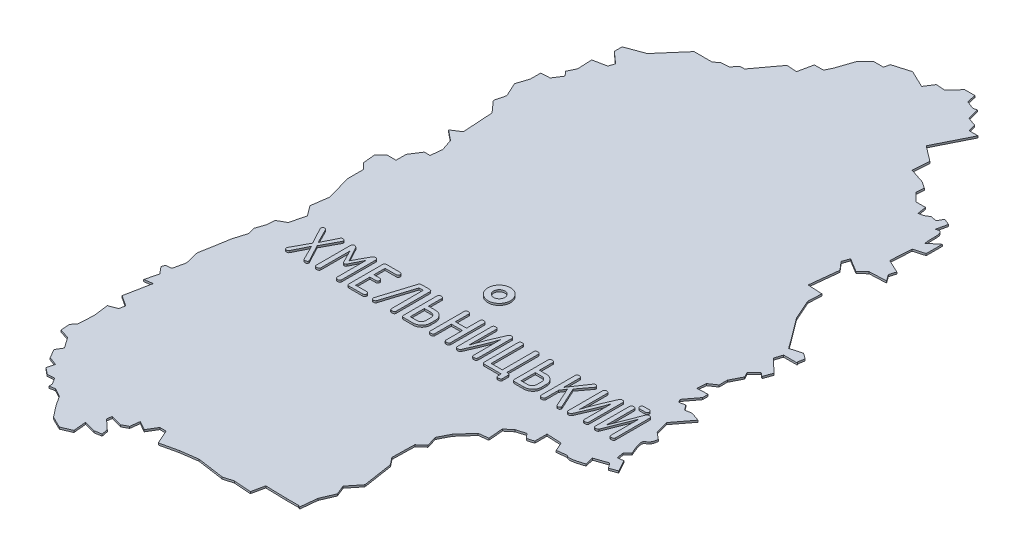
from build123d import *

# Parameters (mm, degrees)
EXTRUDE_1_DEPTH = 5
SKETCH_2_R      = 30
SKETCH_2_R_2    = 15
EXTRUDE_2_DEPTH = 10
SCALE_1_SCALE   = 0.05


with BuildPart() as part:
    # Эскиз1 → Бобышка-Вытянуть1 (new body)
    with BuildSketch(Plane(origin=(0, 0, 0), x_dir=(1, 0, 0), z_dir=(0, 1, 0))):
        with BuildLine():
            Line((-2536.57608, 8613.54894), (-2553.45184, 8644.0645))
            Line((-2553.45184, 8644.0645), (-2569.02204, 8642.12648))
            Line((-2569.02204, 8642.12648), (-2572.25546, 8660.9301))
            Line((-2572.25546, 8660.9301), (-2560.5867, 8673.25418))
            add(Edge.make_bspline(
                [(-2560.5867, 8673.25418), (-2579.40048, 8714.14564), (-2569.02204, 8717.39684)],
                knots=[0.013761468, 0.013761468, 0.013761468, 0.018348624, 0.018348624, 0.018348624], degree=2))
            add(Edge.make_bspline(
                [(-2569.02204, 8717.39684), (-2558.64106, 8720.62518), (-2556.69034, 8739.4542)],
                knots=[0.018348624, 0.018348624, 0.018348624, 0.02293578, 0.02293578, 0.02293578], degree=2))
            Line((-2556.69034, 8739.4542), (-2575.48888, 8755.0244))
            Line((-2575.48888, 8755.0244), (-2584.5897, 8789.41854))
            Line((-2584.5897, 8789.41854), (-2548.24992, 8836.78192))
            Line((-2548.24992, 8836.78192), (-2572.25546, 8845.22488))
            Line((-2572.25546, 8845.22488), (-2589.1363, 8841.98892))
            Line((-2589.1363, 8841.98892), (-2599.51474, 8855.62618))
            Line((-2599.51474, 8855.62618), (-2615.07732, 8852.36482))
            Line((-2615.07732, 8852.36482), (-2620.28432, 8860.81032))
            Line((-2620.28432, 8860.81032), (-2594.3306, 8895.17652))
            Line((-2594.3306, 8895.17652), (-2594.3306, 8910.13204))
            Line((-2594.3306, 8910.13204), (-2623.52028, 8908.83156))
            Line((-2623.52028, 8908.83156), (-2621.58226, 8932.8498))
            Line((-2621.58226, 8932.8498), (-2601.46546, 8946.46928))
            Line((-2601.46546, 8946.46928), (-2601.46546, 8968.52156))
            Line((-2601.46546, 8968.52156), (-2585.89526, 8999.0168))
            Line((-2585.89526, 8999.0168), (-2593.0352, 9012.65406))
            Line((-2593.0352, 9012.65406), (-2574.22142, 9031.47546))
            Line((-2574.22142, 9031.47546), (-2563.81758, 9023.02742))
            Line((-2563.81758, 9023.02742), (-2555.38478, 9047.0355))
            Line((-2555.38478, 9047.0355), (-2591.06924, 9080.78702))
            Line((-2591.06924, 9080.78702), (-2584.5897, 9101.55914))
            Line((-2584.5897, 9101.55914), (-2546.94436, 9101.55914))
            Line((-2546.94436, 9101.55914), (-2550.21334, 9103.50986))
            Line((-2550.21334, 9103.50986), (-2546.94436, 9121.66832))
            Line((-2546.94436, 9121.66832), (-2563.18512, 9133.3574))
            Line((-2563.18512, 9133.3574), (-2563.81758, 9132.06454))
            Line((-2563.81758, 9132.06454), (-2593.0352, 9123.6292))
            Line((-2593.0352, 9123.6292), (-2607.9577, 9144.38354))
            Line((-2607.9577, 9144.38354), (-2652.71758, 9204.09386))
            Line((-2652.71758, 9204.09386), (-2676.73836, 9258.5921))
            Line((-2676.73836, 9258.5921), (-2674.78256, 9294.28164))
            Line((-2674.78256, 9294.28164), (-2713.72584, 9296.23744))
            Line((-2713.72584, 9296.23744), (-2705.2905, 9372.8032))
            Line((-2705.2905, 9372.8032), (-2724.11444, 9394.88088))
            Line((-2724.11444, 9394.88088), (-2717.62982, 9413.69212))
            Line((-2717.62982, 9413.69212), (-2681.27988, 9391.62714))
            Line((-2681.27988, 9391.62714), (-2663.1138, 9408.5029))
            Line((-2663.1138, 9408.5029), (-2618.34122, 9410.44346))
            Line((-2618.34122, 9410.44346), (-2630.678, 9427.3243))
            Line((-2630.678, 9427.3243), (-2625.48878, 9444.84268))
            Line((-2625.48878, 9444.84268), (-2661.1707, 9461.70574))
            Line((-2661.1707, 9461.70574), (-2657.9195, 9518.1801))
            Line((-2657.9195, 9518.1801), (-2628.72728, 9526.61544))
            Line((-2628.72728, 9526.61544), (-2628.72728, 9569.44492))
            Line((-2628.72728, 9569.44492), (-2654.03076, 9548.68042))
            add(Edge.make_bspline(
                [(-2654.03076, 9548.68042), (-2655.97386, 9555.16504), (-2655.97386, 9579.17312)],
                knots=[0.229357798, 0.229357798, 0.229357798, 0.233944954, 0.233944954, 0.233944954], degree=2))
            add(Edge.make_bspline(
                [(-2655.97386, 9579.17312), (-2655.97386, 9603.2066), (-2672.85216, 9594.75348)],
                knots=[0.233944954, 0.233944954, 0.233944954, 0.23853211, 0.23853211, 0.23853211], degree=2))
            Line((-2672.85216, 9594.75348), (-2666.35484, 9623.94824))
            Line((-2666.35484, 9623.94824), (-2683.22298, 9630.44302))
            Line((-2683.22298, 9630.44302), (-2691.66594, 9615.51798))
            Line((-2691.66594, 9615.51798), (-2707.22344, 9618.75902))
            Line((-2707.22344, 9618.75902), (-2718.93792, 9611.61146))
            Line((-2718.93792, 9611.61146), (-2732.56248, 9608.36534))
            Line((-2732.56248, 9608.36534), (-2736.44106, 9632.38612))
            Line((-2736.44106, 9632.38612), (-2761.74454, 9632.38612))
            Line((-2761.74454, 9632.38612), (-2783.8146, 9654.45872))
            Line((-2783.8146, 9654.45872), (-2782.51412, 9675.21052))
            Line((-2782.51412, 9675.21052), (-2799.37718, 9686.89706))
            Line((-2799.37718, 9686.89706), (-2840.27626, 9700.52416))
            Line((-2840.27626, 9700.52416), (-2837.03014, 9744.65412))
            Line((-2837.03014, 9744.65412), (-2877.9089, 9775.78944))
            Line((-2877.9089, 9775.78944), (-2831.83076, 9867.95334))
            Line((-2831.83076, 9867.95334), (-2855.83884, 9867.95334))
            Line((-2855.83884, 9867.95334), (-2861.05092, 9888.07014))
            Line((-2861.05092, 9888.07014), (-2884.39352, 9896.50548))
            Line((-2884.39352, 9896.50548), (-2892.83648, 9927.00072))
            Line((-2892.83648, 9927.00072), (-2901.9246, 9924.41754))
            Line((-2901.9246, 9924.41754), (-2923.9845, 9932.85542))
            Line((-2923.9845, 9932.85542), (-2929.18642, 9956.85588))
            Line((-2929.18642, 9956.85588), (-2956.42284, 9956.85588))
            Line((-2956.42284, 9956.85588), (-2981.73394, 9928.94382))
            Line((-2981.73394, 9928.94382), (-3005.74202, 9930.89708))
            Line((-3005.74202, 9930.89708), (-3021.3173, 9906.88392))
            Line((-3021.3173, 9906.88392), (-3067.41576, 9928.94382))
            Line((-3067.41576, 9928.94382), (-3113.45834, 9915.32434))
            Line((-3113.45834, 9915.32434), (-3116.707, 9900.40946))
            Line((-3116.707, 9900.40946), (-3142.66834, 9900.40946))
            Line((-3142.66834, 9900.40946), (-3166.02872, 9876.38868))
            Line((-3166.02872, 9876.38868), (-3181.6167, 9830.31816))
            Line((-3181.6167, 9830.31816), (-3190.05458, 9813.45002))
            Line((-3190.05458, 9813.45002), (-3214.06012, 9813.45002))
            Line((-3214.06012, 9813.45002), (-3222.50562, 9773.84126))
            Line((-3222.50562, 9773.84126), (-3249.7395, 9775.78944))
            Line((-3249.7395, 9775.78944), (-3297.7582, 9710.91276))
            Line((-3297.7582, 9710.91276), (-3309.46252, 9710.91276))
            Line((-3309.46252, 9710.91276), (-3323.07438, 9695.33494))
            Line((-3323.07438, 9695.33494), (-3343.83634, 9694.0497))
            Line((-3343.83634, 9694.0497), (-3357.47868, 9683.6484))
            Line((-3357.47868, 9683.6484), (-3405.51008, 9683.6484))
            Line((-3405.51008, 9683.6484), (-3463.24174, 9616.81338))
            Line((-3463.24174, 9616.81338), (-3512.57616, 9598.62952))
            Line((-3512.57616, 9598.62952), (-3512.57616, 9577.8828))
            Line((-3512.57616, 9577.8828), (-3482.07584, 9550.6286))
            Line((-3482.07584, 9550.6286), (-3487.25744, 9535.05078))
            Line((-3487.25744, 9535.05078), (-3512.57616, 9529.8514))
            Line((-3512.57616, 9529.8514), (-3522.94698, 9527.921))
            Line((-3522.94698, 9527.921), (-3521.00896, 9488.97772))
            Line((-3521.00896, 9488.97772), (-3531.39756, 9466.92798))
            Line((-3531.39756, 9466.92798), (-3521.00896, 9454.58358))
            Line((-3521.00896, 9454.58358), (-3536.58678, 9430.5755))
            Line((-3536.58678, 9430.5755), (-3560.58216, 9429.26232))
            Line((-3560.58216, 9429.26232), (-3560.58216, 9402.0259))
            Line((-3560.58216, 9402.0259), (-3570.96822, 9369.56978))
            Line((-3570.96822, 9369.56978), (-3553.44222, 9331.94476))
            Line((-3553.44222, 9331.94476), (-3560.58216, 9302.73476))
            Line((-3560.58216, 9302.73476), (-3533.33304, 9272.23444))
            Line((-3533.33304, 9272.23444), (-3528.13112, 9190.4566))
            Line((-3528.13112, 9190.4566), (-3552.1646, 9174.90164))
            Line((-3552.1646, 9174.90164), (-3524.90024, 9152.82904))
            Line((-3524.90024, 9152.82904), (-3514.50656, 9121.66832))
            Line((-3514.50656, 9121.66832), (-3517.75268, 9091.168))
            Line((-3517.75268, 9091.168), (-3533.33304, 9091.168))
            Line((-3533.33304, 9091.168), (-3552.1646, 9061.97324))
            Line((-3552.1646, 9061.97324), (-3552.1646, 9034.72158))
            Line((-3552.1646, 9034.72158), (-3577.46554, 9034.72158))
            Line((-3577.46554, 9034.72158), (-3593.03828, 9017.8382))
            Line((-3593.03828, 9017.8382), (-3589.81248, 8985.39732))
            Line((-3589.81248, 8985.39732), (-3574.21434, 8969.82458))
            Line((-3574.21434, 8969.82458), (-3574.21434, 8927.64534))
            Line((-3574.21434, 8927.64534), (-3555.40564, 8860.81032))
            Line((-3555.40564, 8860.81032), (-3561.88518, 8814.72456))
            Line((-3561.88518, 8814.72456), (-3541.77346, 8787.46274))
            Line((-3541.77346, 8787.46274), (-3552.1646, 8746.60176))
            Line((-3552.1646, 8746.60176), (-3574.21434, 8734.26498))
            Line((-3574.21434, 8734.26498), (-3576.15744, 8712.19492))
            Line((-3576.15744, 8712.19492), (-3584.60294, 8686.89398))
            Line((-3584.60294, 8686.89398), (-3579.41372, 8668.0802))
            Line((-3579.41372, 8668.0802), (-3589.81248, 8633.67082))
            Line((-3589.81248, 8633.67082), (-3594.33368, 8606.42678))
            Line((-3594.33368, 8606.42678), (-3603.41164, 8555.15688))
            Line((-3603.41164, 8555.15688), (-3594.33368, 8517.51154))
            Line((-3594.33368, 8517.51154), (-3601.47362, 8485.71328))
            Line((-3601.47362, 8485.71328), (-3617.0362, 8483.77018))
            Line((-3617.0362, 8483.77018), (-3620.30518, 8475.33484))
            Line((-3620.30518, 8475.33484), (-3604.73244, 8456.50328))
            Line((-3604.73244, 8456.50328), (-3613.16016, 8422.12184))
            Line((-3613.16016, 8422.12184), (-3591.0901, 8425.3705))
            Line((-3591.0901, 8425.3705), (-3604.73244, 8355.94214))
            Line((-3604.73244, 8355.94214), (-3576.15744, 8337.10804))
            Line((-3576.15744, 8337.10804), (-3579.41372, 8321.5226))
            Line((-3579.41372, 8321.5226), (-3601.47362, 8313.10504))
            Line((-3601.47362, 8313.10504), (-3596.2844, 8273.5039))
            Line((-3596.2844, 8273.5039), (-3598.23004, 8232.63784))
            Line((-3598.23004, 8232.63784), (-3608.62372, 8219.00058))
            Line((-3608.62372, 8219.00058), (-3606.66538, 8195.00266))
            Line((-3606.66538, 8195.00266), (-3580.71674, 8186.56478))
            Line((-3580.71674, 8186.56478), (-3560.58216, 8158.00502))
            Line((-3560.58216, 8158.00502), (-3570.96822, 8140.4841))
            Line((-3570.96822, 8140.4841), (-3557.35636, 8116.48364))
            Line((-3557.35636, 8116.48364), (-3534.64622, 8108.04576))
            Line((-3534.64622, 8108.04576), (-3539.82528, 8087.9315))
            Line((-3539.82528, 8087.9315), (-3522.94698, 8074.31456))
            Line((-3522.94698, 8074.31456), (-3512.57616, 8074.93178))
            Line((-3512.57616, 8074.93178), (-3504.13574, 8075.58964))
            Line((-3504.13574, 8075.58964), (-3493.74968, 8058.70118))
            Line((-3493.74968, 8058.70118), (-3493.10198, 8048.96536))
            Line((-3493.10198, 8048.96536), (-3478.8221, 8052.22926))
            Line((-3478.8221, 8052.22926), (-3456.1145, 8039.89502))
            Line((-3456.1145, 8039.89502), (-3437.95096, 8012.6332))
            Line((-3437.95096, 8012.6332), (-3415.24336, 7983.45114))
            Line((-3415.24336, 7983.45114), (-3384.73542, 7968.5134))
            Line((-3384.73542, 7968.5134), (-3357.47868, 7980.21518))
            Line((-3357.47868, 7980.21518), (-3360.7248, 8014.57884))
            Line((-3360.7248, 8014.57884), (-3330.2321, 8006.14858))
            Line((-3330.2321, 8006.14858), (-3311.38784, 8009.40486))
            Line((-3311.38784, 8009.40486), (-3314.63904, 8026.27554))
            Line((-3314.63904, 8026.27554), (-3340.59784, 8050.27854))
            Line((-3340.59784, 8050.27854), (-3338.64966, 8063.90818))
            Line((-3338.64966, 8063.90818), (-3308.15442, 8055.47538))
            Line((-3308.15442, 8055.47538), (-3292.58422, 8063.90818))
            Line((-3292.58422, 8063.90818), (-3289.32794, 8089.2142))
            Line((-3289.32794, 8089.2142), (-3265.3224, 8075.58964))
            Line((-3265.3224, 8075.58964), (-3249.7395, 8101.56114))
            Line((-3249.7395, 8101.56114), (-3232.89676, 8101.56114))
            Line((-3232.89676, 8101.56114), (-3215.99306, 8063.90818))
            Line((-3215.99306, 8063.90818), (-3169.9327, 8074.31456))
            Line((-3169.9327, 8074.31456), (-3123.85964, 8080.756))
            Line((-3123.85964, 8080.756), (-3087.51478, 8075.58964))
            Line((-3087.51478, 8075.58964), (-3051.83794, 8070.40042))
            Line((-3051.83794, 8070.40042), (-3026.5243, 8077.53528))
            Line((-3026.5243, 8077.53528), (-2980.44362, 8074.31456))
            Line((-2980.44362, 8074.31456), (-2973.29352, 8108.04576))
            Line((-2973.29352, 8108.04576), (-2916.85726, 8106.7275))
            Line((-2916.85726, 8106.7275), (-2884.39352, 8106.7275))
            Line((-2884.39352, 8106.7275), (-2879.217, 8104.14686))
            Line((-2879.217, 8104.14686), (-2874.6704, 8148.90928))
            Line((-2874.6704, 8148.90928), (-2859.09004, 8185.2643))
            Line((-2859.09004, 8185.2643), (-2869.47356, 8210.5627))
            Line((-2869.47356, 8210.5627), (-2843.50968, 8243.00866))
            Line((-2843.50968, 8243.00866), (-2855.83884, 8323.4784))
            Line((-2855.83884, 8323.4784), (-2870.78166, 8342.30996))
            Line((-2870.78166, 8342.30996), (-2869.47356, 8402.01012))
            Line((-2869.47356, 8402.01012), (-2850.64962, 8418.87318))
            Line((-2850.64962, 8418.87318), (-2859.09004, 8446.14008))
            Line((-2859.09004, 8446.14008), (-2843.50968, 8476.62516))
            Line((-2843.50968, 8476.62516), (-2811.07134, 8512.97256))
            Line((-2811.07134, 8512.97256), (-2785.7577, 8516.2263))
            Line((-2785.7577, 8516.2263), (-2789.01652, 8555.15688))
            Line((-2789.01652, 8555.15688), (-2770.17988, 8570.7347))
            Line((-2770.17988, 8570.7347), (-2746.17434, 8577.85686))
            Line((-2746.17434, 8577.85686), (-2734.49542, 8565.53532))
            Line((-2734.49542, 8565.53532), (-2717.62982, 8570.7347))
            Line((-2717.62982, 8570.7347), (-2717.62982, 8603.18066))
            Line((-2717.62982, 8603.18066), (-2678.03376, 8601.23502))
            Line((-2678.03376, 8601.23502), (-2667.65532, 8577.85686))
            Line((-2667.65532, 8577.85686), (-2640.4062, 8581.10298))
            add(Edge.make_bspline(
                [(-2640.4062, 8581.10298), (-2633.9165, 8572.68542), (-2596.27624, 8586.29728)],
                knots=[0.967889908, 0.967889908, 0.967889908, 0.972477064, 0.972477064, 0.972477064], degree=2))
            Line((-2596.27624, 8586.29728), (-2601.46546, 8608.37496))
            Line((-2601.46546, 8608.37496), (-2567.07132, 8620.04626))
            Line((-2567.07132, 8620.04626), (-2556.69034, 8606.42678))
            Line((-2556.69034, 8606.42678), (-2536.57608, 8613.54894))
        make_face()
    extrude(amount=EXTRUDE_1_DEPTH)

    # Эскиз2 → Бобышка-Вытянуть2 (add)
    # profile 1 of 14: a face of its own
    with BuildSketch(Plane(origin=(0, 0, 0), x_dir=(1, 0, 0), z_dir=(0, 1, 0))):
        with Locations((-3099.607470646, 8857.706729714)):
            Circle(SKETCH_2_R)
        with Locations((-3099.607470646, 8857.706729714)):
            Circle(SKETCH_2_R_2, mode=Mode.SUBTRACT)
    # profile 2 of 14: a face of its own
    with BuildSketch(Plane(origin=(0, 0, 0), x_dir=(1, 0, 0), z_dir=(0, 1, 0))):
        with BuildLine():
            Line((-3460.92209418, 8735.537320489), (-3441.306384721, 8774.789854272))
            add(Edge.make_bspline(
                [(-3441.306384721, 8774.789854272), (-3441.058528212, 8775.185894724), (-3440.584296564, 8775.943651371), (-3439.584521786, 8776.788070374), (-3438.426028433, 8777.318467114), (-3437.595911207, 8777.377604191), (-3437.167871207, 8777.408097516)],
                knots=[0, 0, 0, 0, 1.08367056, 2.073420948, 3.006582599, 4, 4, 4, 4], degree=3))
            add(Edge.make_bspline(
                [(-3437.167871207, 8777.408097516), (-3436.667567997, 8777.3895065), (-3435.725434722, 8777.354497302), (-3434.404941345, 8777.161574718), (-3433.275374921, 8776.783337273), (-3432.355464168, 8776.231786616), (-3431.618603013, 8775.532582596), (-3431.103921511, 8774.664499325), (-3430.806557667, 8773.640294015), (-3430.768786838, 8772.912663472), (-3430.748952288, 8772.530563732)],
                knots=[0, 0, 0, 0, 1.307585369, 2.462346159, 3.474162086, 4.39812442, 5.243351347, 6.101086129, 7.002825675, 8, 8, 8, 8], degree=3))
            add(Edge.make_bspline(
                [(-3430.748952288, 8772.530563732), (-3430.804266376, 8772.180852614), (-3430.938305254, 8771.333421387), (-3431.337798461, 8770.571164165), (-3431.572432018, 8770.123469137)],
                knots=[0, 0, 0, 0, 0.825343951, 2, 2, 2, 2], degree=3))
            Line((-3431.572432018, 8770.123469137), (-3454.819898234, 8726.711306975))
            Line((-3454.819898234, 8726.711306975), (-3431.572432018, 8683.320259678))
            add(Edge.make_bspline(
                [(-3431.572432018, 8683.320259678), (-3431.338142162, 8682.87252229), (-3430.94245803, 8682.116353917), (-3430.80501391, 8681.276745154), (-3430.748952288, 8680.934279948)],
                knots=[0, 0, 0, 0, 1.184226699, 2, 2, 2, 2], degree=3))
            add(Edge.make_bspline(
                [(-3430.748952288, 8680.934279948), (-3430.768786838, 8680.552180208), (-3430.806557667, 8679.824549664), (-3431.103921511, 8678.800344355), (-3431.618603013, 8677.932261084), (-3432.355464168, 8677.233057064), (-3433.275374921, 8676.681506407), (-3434.404941345, 8676.303268962), (-3435.725434722, 8676.110346378), (-3436.667567997, 8676.07533718), (-3437.167871207, 8676.056746164)],
                knots=[0, 0, 0, 0, 0.997174325, 1.898913871, 2.756648653, 3.60187558, 4.525837914, 5.537653841, 6.692414631, 8, 8, 8, 8], degree=3))
            add(Edge.make_bspline(
                [(-3437.167871207, 8676.056746164), (-3437.596198974, 8676.086898098), (-3438.426874279, 8676.145373101), (-3439.577127892, 8676.678665371), (-3440.590976439, 8677.498909905), (-3441.059999046, 8678.256106235), (-3441.306384721, 8678.653874543)],
                knots=[0, 0, 0, 0, 0.996040273, 1.931665706, 2.913468277, 4, 4, 4, 4], degree=3))
            Line((-3441.306384721, 8678.653874543), (-3460.92209418, 8717.927523191))
            Line((-3460.92209418, 8717.927523191), (-3480.558918504, 8678.632759678))
            add(Edge.make_bspline(
                [(-3480.558918504, 8678.632759678), (-3480.824000619, 8678.237194891), (-3481.35680839, 8677.442120531), (-3482.615745686, 8676.638312182), (-3484.131784905, 8676.135161856), (-3485.241592513, 8676.084145447), (-3485.837634721, 8676.056746164)],
                knots=[0, 0, 0, 0, 0.918553309, 1.846266934, 2.843298783, 4, 4, 4, 4], degree=3))
            add(Edge.make_bspline(
                [(-3485.837634721, 8676.056746164), (-3486.232489808, 8676.07542352), (-3486.97906847, 8676.110738034), (-3488.029727111, 8676.305445287), (-3488.927767733, 8676.692352017), (-3489.654539436, 8677.248769816), (-3490.230838019, 8677.955219628), (-3490.630926847, 8678.817404415), (-3490.858297033, 8679.831850681), (-3490.888980223, 8680.553007556), (-3490.905202288, 8680.934279948)],
                knots=[0, 0, 0, 0, 1.176797848, 2.225049625, 3.163618071, 4.060781363, 4.925019092, 5.853231903, 6.865013374, 8, 8, 8, 8], degree=3))
            add(Edge.make_bspline(
                [(-3490.905202288, 8680.934279948), (-3490.871343663, 8681.34135918), (-3490.802092402, 8682.173960897), (-3490.451126485, 8682.932558762), (-3490.271756342, 8683.320259678)],
                knots=[0, 0, 0, 0, 0.977848649, 2, 2, 2, 2], degree=3))
            Line((-3490.271756342, 8683.320259678), (-3466.834256342, 8726.73242184))
            Line((-3466.834256342, 8726.73242184), (-3490.271756342, 8770.123469137))
            add(Edge.make_bspline(
                [(-3490.271756342, 8770.123469137), (-3490.451174156, 8770.511188703), (-3490.805186922, 8771.276205693), (-3490.872168003, 8772.116259184), (-3490.905202288, 8772.530563732)],
                knots=[0, 0, 0, 0, 1.013623413, 2, 2, 2, 2], degree=3))
            add(Edge.make_bspline(
                [(-3490.905202288, 8772.530563732), (-3490.888980223, 8772.911836124), (-3490.858297033, 8773.632992998), (-3490.630926847, 8774.647439265), (-3490.230838019, 8775.509624052), (-3489.654539436, 8776.216073864), (-3488.927767733, 8776.772491663), (-3488.029727111, 8777.159398393), (-3486.97906847, 8777.354105646), (-3486.232489808, 8777.38942016), (-3485.837634721, 8777.408097516)],
                knots=[0, 0, 0, 0, 1.134986626, 2.146768097, 3.074980908, 3.939218637, 4.836381929, 5.774950375, 6.823202152, 8, 8, 8, 8], degree=3))
            add(Edge.make_bspline(
                [(-3485.837634721, 8777.408097516), (-3485.231707836, 8777.367504056), (-3484.068761176, 8777.289593618), (-3482.452281013, 8776.562596399), (-3481.120286062, 8775.35066317), (-3480.51641264, 8774.289953204), (-3480.199965802, 8773.734111029)],
                knots=[0, 0, 0, 0, 1.01713272, 1.952168043, 2.926877842, 4, 4, 4, 4], degree=3))
            Line((-3480.199965802, 8773.734111029), (-3460.92209418, 8735.537320489))
        make_face()
    # profile 3 of 14: a face of its own
    with BuildSketch(Plane(origin=(0, 0, 0), x_dir=(1, 0, 0), z_dir=(0, 1, 0))):
        with BuildLine():
            add(Edge.make_bspline(
                [(-3343.434763099, 8680.913165083), (-3343.452912462, 8680.530722083), (-3343.487572854, 8679.800359006), (-3343.807601016, 8678.780922654), (-3344.355080725, 8677.920911278), (-3345.129433267, 8677.233289571), (-3346.095002895, 8676.676482401), (-3347.282725233, 8676.305059504), (-3348.671726595, 8676.109198752), (-3349.66300984, 8676.074986618), (-3350.191519856, 8676.056746164)],
                knots=[0, 0, 0, 0, 0.968349646, 1.849286893, 2.676465977, 3.523263178, 4.451261044, 5.484598709, 6.658895142, 8, 8, 8, 8], degree=3))
            add(Edge.make_bspline(
                [(-3350.191519856, 8676.056746164), (-3350.61459758, 8676.075011441), (-3351.410234214, 8676.109360978), (-3352.528582044, 8676.307161723), (-3353.486091982, 8676.685665505), (-3354.257857184, 8677.247947543), (-3354.875115747, 8677.942108188), (-3355.304673268, 8678.799239063), (-3355.555221193, 8679.808149639), (-3355.582523874, 8680.531577495), (-3355.596925261, 8680.913165083)],
                knots=[0, 0, 0, 0, 1.220860227, 2.29594012, 3.261114875, 4.162696787, 5.025975332, 5.915822489, 6.900655729, 8, 8, 8, 8], degree=3))
            Line((-3355.596925261, 8680.913165083), (-3355.596925261, 8758.151340759))
            Line((-3355.596925261, 8758.151340759), (-3372.721080667, 8724.050834002))
            add(Edge.make_bspline(
                [(-3372.721080667, 8724.050834002), (-3373.013100498, 8723.612425188), (-3373.578258607, 8722.763954401), (-3374.842744269, 8721.881173373), (-3376.302100684, 8721.288268596), (-3377.373870542, 8721.244445337), (-3377.936452288, 8721.22144211)],
                knots=[0, 0, 0, 0, 1.006547439, 1.948013064, 2.922893393, 4, 4, 4, 4], degree=3))
            add(Edge.make_bspline(
                [(-3377.936452288, 8721.22144211), (-3378.343934934, 8721.279594514), (-3379.212137238, 8721.403496847), (-3380.356095954, 8722.366645126), (-3381.349509912, 8723.805755636), (-3381.884154488, 8724.98224826), (-3382.180540126, 8725.634448867)],
                knots=[0, 0, 0, 0, 0.752435078, 1.603174698, 2.671295606, 4, 4, 4, 4], degree=3))
            Line((-3382.180540126, 8725.634448867), (-3398.840168504, 8758.151340759))
            Line((-3398.840168504, 8758.151340759), (-3398.840168504, 8680.913165083))
            add(Edge.make_bspline(
                [(-3398.840168504, 8680.913165083), (-3398.858317867, 8680.530722083), (-3398.892978259, 8679.800359006), (-3399.213006421, 8678.780922654), (-3399.76048613, 8677.920911278), (-3400.534838672, 8677.233289571), (-3401.5004083, 8676.676482401), (-3402.688130639, 8676.305059504), (-3404.077132, 8676.109198752), (-3405.068415246, 8676.074986618), (-3405.596925261, 8676.056746164)],
                knots=[0, 0, 0, 0, 0.968349646, 1.849286893, 2.676465977, 3.523263178, 4.451261044, 5.484598709, 6.658895142, 8, 8, 8, 8], degree=3))
            add(Edge.make_bspline(
                [(-3405.596925261, 8676.056746164), (-3406.020002986, 8676.075011441), (-3406.81563962, 8676.109360978), (-3407.93398745, 8676.307161723), (-3408.891497388, 8676.685665505), (-3409.663262589, 8677.247947543), (-3410.280521153, 8677.942108188), (-3410.710078673, 8678.799239063), (-3410.960626598, 8679.808149639), (-3410.98792928, 8680.531577495), (-3411.002330667, 8680.913165083)],
                knots=[0, 0, 0, 0, 1.220860227, 2.29594012, 3.261114875, 4.162696787, 5.025975332, 5.915822489, 6.900655729, 8, 8, 8, 8], degree=3))
            Line((-3411.002330667, 8680.913165083), (-3411.002330667, 8771.981577245))
            add(Edge.make_bspline(
                [(-3411.002330667, 8771.981577245), (-3410.989415398, 8772.405818304), (-3410.96503816, 8773.206562396), (-3410.697223449, 8774.322206229), (-3410.319286641, 8775.301817197), (-3409.700242089, 8776.077726593), (-3408.939741735, 8776.693753396), (-3408.00850657, 8777.110388433), (-3406.920091708, 8777.37037839), (-3406.140574247, 8777.394952795), (-3405.72361445, 8777.408097516)],
                knots=[0, 0, 0, 0, 1.17117569, 2.210564007, 3.161919999, 4.050178772, 4.923145732, 5.846785378, 6.848256806, 8, 8, 8, 8], degree=3))
            add(Edge.make_bspline(
                [(-3405.72361445, 8777.408097516), (-3405.062830194, 8777.371621289), (-3403.762875988, 8777.299861978), (-3401.924537211, 8776.602918536), (-3400.263933461, 8775.500110194), (-3399.381574985, 8774.489657647), (-3398.924627964, 8773.966374543)],
                knots=[0, 0, 0, 0, 1.000789268, 1.968842638, 2.94812445, 4, 4, 4, 4], degree=3))
            Line((-3398.924627964, 8773.966374543), (-3377.366350937, 8734.46046238))
            Line((-3377.366350937, 8734.46046238), (-3355.406891477, 8774.536475894))
            add(Edge.make_bspline(
                [(-3355.406891477, 8774.536475894), (-3355.031755179, 8774.979552496), (-3354.318105092, 8775.822450552), (-3352.985567447, 8776.716527724), (-3351.572816088, 8777.328801045), (-3350.570897309, 8777.381486318), (-3350.064830667, 8777.408097516)],
                knots=[0, 0, 0, 0, 1.103169351, 2.098642303, 3.039629035, 4, 4, 4, 4], degree=3))
            add(Edge.make_bspline(
                [(-3350.064830667, 8777.408097516), (-3349.542786569, 8777.394702773), (-3348.568968422, 8777.369716294), (-3347.207406636, 8777.116081111), (-3346.045424309, 8776.696717556), (-3345.071186304, 8776.110873658), (-3344.314774478, 8775.31725229), (-3343.817436769, 8774.338411965), (-3343.483421711, 8773.213588684), (-3343.451548366, 8772.40657171), (-3343.434763099, 8771.981577245)],
                knots=[0, 0, 0, 0, 1.27863041, 2.385150032, 3.378693851, 4.293134735, 5.147492946, 6.027426626, 6.961195624, 8, 8, 8, 8], degree=3))
            Line((-3343.434763099, 8771.981577245), (-3343.434763099, 8680.913165083))
        make_face()
    # profile 4 of 14: a face of its own
    with BuildSketch(Plane(origin=(0, 0, 0), x_dir=(1, 0, 0), z_dir=(0, 1, 0))):
        with BuildLine():
            Line((-3311.948276613, 8724.705394813), (-3311.948276613, 8686.867556975))
            Line((-3311.948276613, 8686.867556975), (-3283.189830667, 8686.867556975))
            add(Edge.make_bspline(
                [(-3283.189830667, 8686.867556975), (-3282.703113956, 8686.853137101), (-3281.785507105, 8686.825951319), (-3280.504872031, 8686.580571665), (-3279.415692779, 8686.151119135), (-3278.504255125, 8685.563749669), (-3277.807419963, 8684.770725775), (-3277.309033124, 8683.816836808), (-3277.04547703, 8682.686342488), (-3277.004001942, 8681.885709855), (-3276.982060396, 8681.46215157)],
                knots=[0, 0, 0, 0, 1.239032302, 2.335947183, 3.301339876, 4.206248485, 5.069721959, 5.959770044, 6.920658157, 8, 8, 8, 8], degree=3))
            add(Edge.make_bspline(
                [(-3276.982060396, 8681.46215157), (-3277.004001942, 8681.038593284), (-3277.04547703, 8680.237960651), (-3277.309033124, 8679.107466331), (-3277.807419963, 8678.153577364), (-3278.504255125, 8677.36055347), (-3279.415692779, 8676.773184005), (-3280.504872031, 8676.343731474), (-3281.785507105, 8676.09835182), (-3282.703113956, 8676.071166038), (-3283.189830667, 8676.056746164)],
                knots=[0, 0, 0, 0, 1.079341843, 2.040229956, 2.930278041, 3.793751515, 4.698660124, 5.664052817, 6.760967698, 8, 8, 8, 8], degree=3))
            Line((-3283.189830667, 8676.056746164), (-3318.705033369, 8676.056746164))
            add(Edge.make_bspline(
                [(-3318.705033369, 8676.056746164), (-3319.127995573, 8676.075180301), (-3319.923414959, 8676.109847394), (-3321.043195126, 8676.305554456), (-3321.992235582, 8676.689345513), (-3322.776966326, 8677.225157357), (-3323.394653791, 8677.925848108), (-3323.808840464, 8678.788712919), (-3324.072489642, 8679.792826195), (-3324.097252629, 8680.510103996), (-3324.110438775, 8680.892050218)],
                knots=[0, 0, 0, 0, 1.22289028, 2.299757822, 3.266537475, 4.157864275, 5.022578284, 5.932048079, 6.898827733, 8, 8, 8, 8], degree=3))
            Line((-3324.110438775, 8680.892050218), (-3324.110438775, 8771.22144211))
            add(Edge.make_bspline(
                [(-3324.110438775, 8771.22144211), (-3324.097252629, 8771.603388332), (-3324.072489642, 8772.320666134), (-3323.808840464, 8773.324779409), (-3323.394653791, 8774.18764422), (-3322.776966326, 8774.888334971), (-3321.992235582, 8775.424146815), (-3321.043195126, 8775.807937872), (-3319.923414959, 8776.003644934), (-3319.127995573, 8776.038312027), (-3318.705033369, 8776.056746164)],
                knots=[0, 0, 0, 0, 1.101172267, 2.067951921, 2.977421716, 3.842135725, 4.733462525, 5.700242178, 6.77710972, 8, 8, 8, 8], degree=3))
            Line((-3318.705033369, 8776.056746164), (-3283.189830667, 8776.056746164))
            add(Edge.make_bspline(
                [(-3283.189830667, 8776.056746164), (-3282.703113956, 8776.042326291), (-3281.785507105, 8776.015140508), (-3280.504872031, 8775.769760855), (-3279.415692779, 8775.340308324), (-3278.504255125, 8774.752938858), (-3277.807419963, 8773.959914965), (-3277.309033124, 8773.006025997), (-3277.04547703, 8771.875531678), (-3277.004001942, 8771.074899044), (-3276.982060396, 8770.651340759)],
                knots=[0, 0, 0, 0, 1.239032302, 2.335947183, 3.301339876, 4.206248485, 5.069721959, 5.959770044, 6.920658157, 8, 8, 8, 8], degree=3))
            add(Edge.make_bspline(
                [(-3276.982060396, 8770.651340759), (-3277.004001942, 8770.227782473), (-3277.04547703, 8769.42714984), (-3277.309033124, 8768.296655521), (-3277.807419963, 8767.342766553), (-3278.504255125, 8766.549742659), (-3279.415692779, 8765.962373194), (-3280.504872031, 8765.532920663), (-3281.785507105, 8765.28754101), (-3282.703113956, 8765.260355227), (-3283.189830667, 8765.245935353)],
                knots=[0, 0, 0, 0, 1.079341843, 2.040229956, 2.930278041, 3.793751515, 4.698660124, 5.664052817, 6.760967698, 8, 8, 8, 8], degree=3))
            Line((-3283.189830667, 8765.245935353), (-3311.948276613, 8765.245935353))
            Line((-3311.948276613, 8765.245935353), (-3311.948276613, 8735.516205624))
            Line((-3311.948276613, 8735.516205624), (-3297.167871207, 8735.516205624))
            add(Edge.make_bspline(
                [(-3297.167871207, 8735.516205624), (-3296.681154497, 8735.50178575), (-3295.763547646, 8735.474599967), (-3294.482912572, 8735.229220314), (-3293.393733319, 8734.799767783), (-3292.482295666, 8734.212398318), (-3291.785460504, 8733.419374424), (-3291.287073665, 8732.465485457), (-3291.02351757, 8731.334991137), (-3290.982042482, 8730.534358504), (-3290.960100937, 8730.110800218)],
                knots=[0, 0, 0, 0, 1.239032302, 2.335947183, 3.301339876, 4.206248485, 5.069721959, 5.959770044, 6.920658157, 8, 8, 8, 8], degree=3))
            add(Edge.make_bspline(
                [(-3290.960100937, 8730.110800218), (-3290.982042482, 8729.687241933), (-3291.02351757, 8728.886609299), (-3291.287073665, 8727.75611498), (-3291.785460504, 8726.802226012), (-3292.482295666, 8726.009202119), (-3293.393733319, 8725.421832653), (-3294.482912572, 8724.992380122), (-3295.763547646, 8724.747000469), (-3296.681154497, 8724.719814686), (-3297.167871207, 8724.705394813)],
                knots=[0, 0, 0, 0, 1.079341843, 2.040229956, 2.930278041, 3.793751515, 4.698660124, 5.664052817, 6.760967698, 8, 8, 8, 8], degree=3))
            Line((-3297.167871207, 8724.705394813), (-3311.948276613, 8724.705394813))
        make_face()
    # profile 5 of 14: a face of its own
    with BuildSketch(Plane(origin=(0, 0, 0), x_dir=(1, 0, 0), z_dir=(0, 1, 0))):
        with BuildLine():
            add(Edge.make_bspline(
                [(-3198.029357694, 8680.892050218), (-3198.046122368, 8680.509091577), (-3198.077844173, 8679.784464335), (-3198.413051692, 8678.772068799), (-3198.942457823, 8677.903146302), (-3199.719355491, 8677.209675934), (-3200.696260508, 8676.681667439), (-3201.876250944, 8676.303059651), (-3203.266649308, 8676.109812654), (-3204.257718538, 8676.075200103), (-3204.78611445, 8676.056746164)],
                knots=[0, 0, 0, 0, 0.969647621, 1.834749252, 2.678145047, 3.526077294, 4.446504318, 5.481227067, 6.657097526, 8, 8, 8, 8], degree=3))
            add(Edge.make_bspline(
                [(-3204.78611445, 8676.056746164), (-3205.209105559, 8676.075152376), (-3206.004579302, 8676.109766952), (-3207.124001083, 8676.305820261), (-3208.074205033, 8676.688487234), (-3208.850685807, 8677.225046548), (-3209.475710478, 8677.90215648), (-3209.89399017, 8678.751861075), (-3210.151065736, 8679.743955819), (-3210.177543301, 8680.453933784), (-3210.191519856, 8680.828705624)],
                knots=[0, 0, 0, 0, 1.231142298, 2.315276502, 3.288579949, 4.185921389, 5.041168779, 5.938510218, 6.911813665, 8, 8, 8, 8], degree=3))
            Line((-3210.191519856, 8680.828705624), (-3210.191519856, 8765.245935353))
            Line((-3210.191519856, 8765.245935353), (-3221.382398234, 8765.245935353))
            Line((-3221.382398234, 8765.245935353), (-3248.367195531, 8679.456239407))
            add(Edge.make_bspline(
                [(-3248.367195531, 8679.456239407), (-3248.583211724, 8678.938756415), (-3249.01117909, 8677.913528487), (-3250.349397847, 8676.783073616), (-3252.12173728, 8676.145661593), (-3253.435685334, 8676.088136132), (-3254.152668504, 8676.056746164)],
                knots=[0, 0, 0, 0, 0.920783868, 1.824240315, 2.812751332, 4, 4, 4, 4], degree=3))
            add(Edge.make_bspline(
                [(-3254.152668504, 8676.056746164), (-3254.547279672, 8676.075749806), (-3255.29339714, 8676.111681251), (-3256.34711957, 8676.302290131), (-3257.227454731, 8676.699207625), (-3257.982887189, 8677.202669655), (-3258.53787317, 8677.911872141), (-3258.943554776, 8678.745716448), (-3259.175594121, 8679.732814466), (-3259.204689926, 8680.433309871), (-3259.220236072, 8680.807590759)],
                knots=[0, 0, 0, 0, 1.192508042, 2.254753928, 3.205852217, 4.08983164, 4.9656069, 5.887070154, 6.871042903, 8, 8, 8, 8], degree=3))
            add(Edge.make_bspline(
                [(-3259.220236072, 8680.807590759), (-3259.198825521, 8681.069097716), (-3259.155636567, 8681.596604563), (-3259.030140281, 8682.110802169), (-3258.966857694, 8682.370090759)],
                knots=[0, 0, 0, 0, 0.991482704, 2, 2, 2, 2], degree=3))
            Line((-3258.966857694, 8682.370090759), (-3230.926317153, 8772.657252921))
            add(Edge.make_bspline(
                [(-3230.926317153, 8772.657252921), (-3230.725590357, 8773.167621279), (-3230.343208416, 8774.139866375), (-3229.273994099, 8775.288573924), (-3227.851966845, 8775.956495319), (-3226.809162608, 8776.022160972), (-3226.259932018, 8776.056746164)],
                knots=[0, 0, 0, 0, 1.049874067, 1.999996468, 2.94662576, 4, 4, 4, 4], degree=3))
            Line((-3226.259932018, 8776.056746164), (-3204.78611445, 8776.056746164))
            add(Edge.make_bspline(
                [(-3204.78611445, 8776.056746164), (-3204.257718538, 8776.038292226), (-3203.266649308, 8776.003679675), (-3201.876250944, 8775.810432678), (-3200.696260508, 8775.43182489), (-3199.719355491, 8774.903816394), (-3198.942457823, 8774.210346027), (-3198.413051692, 8773.341423529), (-3198.077844173, 8772.329027993), (-3198.046122368, 8771.604400752), (-3198.029357694, 8771.22144211)],
                knots=[0, 0, 0, 0, 1.342902474, 2.518772933, 3.553495682, 4.473922706, 5.321854953, 6.165250748, 7.030352379, 8, 8, 8, 8], degree=3))
            Line((-3198.029357694, 8771.22144211), (-3198.029357694, 8680.892050218))
        make_face()
    # profile 6 of 14: a face of its own
    with BuildSketch(Plane(origin=(0, 0, 0), x_dir=(1, 0, 0), z_dir=(0, 1, 0))):
        with BuildLine():
            add(Edge.make_bspline(
                [(-3124.650979315, 8698.712996164), (-3124.671472607, 8697.973002982), (-3124.712065008, 8696.507250209), (-3125.030659876, 8694.338026799), (-3125.595147227, 8692.244979619), (-3126.319987765, 8690.201953129), (-3127.312711212, 8688.252202168), (-3128.496822692, 8686.356941621), (-3129.920283839, 8684.553282858), (-3131.509961093, 8682.822713194), (-3133.278510699, 8681.256410951), (-3135.153878564, 8679.841394948), (-3137.170959852, 8678.688401148), (-3139.284691173, 8677.728365366), (-3141.506800147, 8676.955729837), (-3143.853932535, 8676.444510275), (-3146.305332398, 8676.112669631), (-3147.974738093, 8676.07565426), (-3148.827499585, 8676.056746164)],
                knots=[0, 0, 0, 0, 0.963633486, 1.908731712, 2.847047916, 3.78375066, 4.726667904, 5.690606565, 6.689985837, 7.714895885, 8.747199612, 9.762926321, 10.769218895, 11.7661145, 12.783659731, 13.826693924, 14.88983742, 16, 16, 16, 16], degree=3))
            Line((-3148.827499585, 8676.056746164), (-3173.785269856, 8676.056746164))
            add(Edge.make_bspline(
                [(-3173.785269856, 8676.056746164), (-3174.173121531, 8676.074843765), (-3174.898936418, 8676.108711114), (-3175.922088575, 8676.30752191), (-3176.784633682, 8676.695624108), (-3177.504253809, 8677.227322652), (-3178.052751175, 8677.937423807), (-3178.42227125, 8678.794940088), (-3178.662239626, 8679.795430715), (-3178.690140695, 8680.510415056), (-3178.705033369, 8680.892050218)],
                knots=[0, 0, 0, 0, 1.178388678, 2.205203945, 3.142513155, 4.02719224, 4.89493436, 5.832243571, 6.842922806, 8, 8, 8, 8], degree=3))
            Line((-3178.705033369, 8680.892050218), (-3178.705033369, 8771.22144211))
            add(Edge.make_bspline(
                [(-3178.705033369, 8771.22144211), (-3178.691847224, 8771.603388332), (-3178.667084236, 8772.320666134), (-3178.403435058, 8773.324779409), (-3177.989248385, 8774.18764422), (-3177.37156092, 8774.888334971), (-3176.586830176, 8775.424146815), (-3175.637789721, 8775.807937872), (-3174.518009554, 8776.003644934), (-3173.722590167, 8776.038312027), (-3173.299627964, 8776.056746164)],
                knots=[0, 0, 0, 0, 1.101172267, 2.067951921, 2.977421716, 3.842135725, 4.733462525, 5.700242178, 6.77710972, 8, 8, 8, 8], degree=3))
            add(Edge.make_bspline(
                [(-3173.299627964, 8776.056746164), (-3172.770369682, 8776.051075346), (-3171.776270746, 8776.040423922), (-3170.396925384, 8775.795221244), (-3169.204656079, 8775.460997931), (-3168.240752803, 8774.921516563), (-3167.456420184, 8774.255666093), (-3166.927078917, 8773.405415107), (-3166.591107032, 8772.414132807), (-3166.559555869, 8771.703047515), (-3166.542871207, 8771.327016434)],
                knots=[0, 0, 0, 0, 1.353106154, 2.541521659, 3.579288285, 4.507284885, 5.350131461, 6.185231121, 7.040326791, 8, 8, 8, 8], degree=3))
            Line((-3166.542871207, 8771.327016434), (-3166.542871207, 8735.516205624))
            Line((-3166.542871207, 8735.516205624), (-3148.341857694, 8735.516205624))
            add(Edge.make_bspline(
                [(-3148.341857694, 8735.516205624), (-3147.510466641, 8735.496020658), (-3145.876649129, 8735.456353946), (-3143.475814914, 8735.140631736), (-3141.191294793, 8734.578742628), (-3138.994941813, 8733.851412973), (-3136.929710427, 8732.86901132), (-3134.958138071, 8731.696599277), (-3133.102426552, 8730.303487623), (-3131.382750365, 8728.698474724), (-3129.824441608, 8726.967127389), (-3128.427775057, 8725.164635925), (-3127.273507194, 8723.282779683), (-3126.304153958, 8721.344939676), (-3125.56632558, 8719.332316253), (-3125.03793359, 8717.252515375), (-3124.710123879, 8715.108545315), (-3124.670822004, 8713.656438388), (-3124.650979315, 8712.923300218)],
                knots=[0, 0, 0, 0, 1.096850268, 2.155487685, 3.187140075, 4.197419692, 5.202821391, 6.198265597, 7.219836451, 8.258155485, 9.297055814, 10.290809041, 11.262444892, 12.205247722, 13.145485597, 14.084759807, 15.03303561, 16, 16, 16, 16], degree=3))
            Line((-3124.650979315, 8712.923300218), (-3124.650979315, 8698.712996164))
        make_face()
        with BuildLine():
            Line((-3136.813141477, 8699.050834002), (-3136.813141477, 8712.58546238))
            add(Edge.make_bspline(
                [(-3136.813141477, 8712.58546238), (-3136.858219052, 8713.385544907), (-3136.947258816, 8714.965912981), (-3137.643534568, 8717.23616354), (-3138.801742272, 8719.321223393), (-3140.372786067, 8721.161614115), (-3142.237357118, 8722.723964896), (-3144.326869836, 8723.896865552), (-3146.626700306, 8724.567030455), (-3148.210989402, 8724.658717803), (-3149.017533369, 8724.705394813)],
                knots=[0, 0, 0, 0, 1.005936902, 1.986983231, 2.958581705, 3.989798119, 5.015327389, 6.006721754, 6.985244203, 8, 8, 8, 8], degree=3))
            Line((-3149.017533369, 8724.705394813), (-3166.542871207, 8724.705394813))
            Line((-3166.542871207, 8724.705394813), (-3166.542871207, 8686.867556975))
            Line((-3166.542871207, 8686.867556975), (-3149.017533369, 8686.867556975))
            add(Edge.make_bspline(
                [(-3149.017533369, 8686.867556975), (-3148.203639103, 8686.913187587), (-3146.611674354, 8687.002440366), (-3144.311742932, 8687.680486963), (-3142.211525921, 8688.824752104), (-3140.350756511, 8690.384841093), (-3138.795403092, 8692.250474748), (-3137.621480898, 8694.338812955), (-3136.949480137, 8696.645751714), (-3136.859264402, 8698.2372025), (-3136.813141477, 8699.050834002)],
                knots=[0, 0, 0, 0, 1.019269311, 1.9936752, 2.976671234, 3.99788619, 5.019101147, 6.0063248, 6.980730689, 8, 8, 8, 8], degree=3))
        make_face(mode=Mode.SUBTRACT)
    # profile 7 of 14: a face of its own
    with BuildSketch(Plane(origin=(0, 0, 0), x_dir=(1, 0, 0), z_dir=(0, 1, 0))):
        with BuildLine():
            Line((-3064.78611445, 8735.516205624), (-3064.78611445, 8771.327016434))
            add(Edge.make_bspline(
                [(-3064.78611445, 8771.327016434), (-3064.773015377, 8771.702019579), (-3064.748438438, 8772.405613569), (-3064.484202772, 8773.388435739), (-3064.070813091, 8774.233070424), (-3063.444506003, 8774.907585455), (-3062.673776107, 8775.452590046), (-3061.710397219, 8775.793747978), (-3060.603773936, 8776.039888504), (-3059.804686521, 8776.050902428), (-3059.380709045, 8776.056746164)],
                knots=[0, 0, 0, 0, 1.091529518, 2.047965782, 2.948064081, 3.805939007, 4.706037306, 5.674741692, 6.76627121, 8, 8, 8, 8], degree=3))
            add(Edge.make_bspline(
                [(-3059.380709045, 8776.056746164), (-3058.852313133, 8776.038292226), (-3057.861243903, 8776.003679675), (-3056.470845539, 8775.810432678), (-3055.290855103, 8775.43182489), (-3054.313950085, 8774.903816394), (-3053.537052417, 8774.210346027), (-3053.007646287, 8773.341423529), (-3052.672438767, 8772.329027993), (-3052.640716962, 8771.604400752), (-3052.623952288, 8771.22144211)],
                knots=[0, 0, 0, 0, 1.342902474, 2.518772933, 3.553495682, 4.473922706, 5.321854953, 6.165250748, 7.030352379, 8, 8, 8, 8], degree=3))
            Line((-3052.623952288, 8771.22144211), (-3052.623952288, 8680.892050218))
            add(Edge.make_bspline(
                [(-3052.623952288, 8680.892050218), (-3052.640716962, 8680.509091577), (-3052.672438767, 8679.784464335), (-3053.007646287, 8678.772068799), (-3053.537052417, 8677.903146302), (-3054.313950085, 8677.209675934), (-3055.290855103, 8676.681667439), (-3056.470845539, 8676.303059651), (-3057.861243903, 8676.109812654), (-3058.852313133, 8676.075200103), (-3059.380709045, 8676.056746164)],
                knots=[0, 0, 0, 0, 0.969647621, 1.834749252, 2.678145047, 3.526077294, 4.446504318, 5.481227067, 6.657097526, 8, 8, 8, 8], degree=3))
            add(Edge.make_bspline(
                [(-3059.380709045, 8676.056746164), (-3059.803671248, 8676.075180301), (-3060.599090635, 8676.109847394), (-3061.718870802, 8676.305554456), (-3062.667911257, 8676.689345513), (-3063.452642001, 8677.225157357), (-3064.070329466, 8677.925848108), (-3064.484516139, 8678.788712919), (-3064.748165317, 8679.792826195), (-3064.772928305, 8680.510103996), (-3064.78611445, 8680.892050218)],
                knots=[0, 0, 0, 0, 1.22289028, 2.299757822, 3.266537475, 4.157864275, 5.022578284, 5.932048079, 6.898827733, 8, 8, 8, 8], degree=3))
            Line((-3064.78611445, 8680.892050218), (-3064.78611445, 8724.705394813))
            Line((-3064.78611445, 8724.705394813), (-3094.51584418, 8724.705394813))
            Line((-3094.51584418, 8724.705394813), (-3094.51584418, 8680.892050218))
            add(Edge.make_bspline(
                [(-3094.51584418, 8680.892050218), (-3094.532608854, 8680.509091577), (-3094.564330659, 8679.784464335), (-3094.899538179, 8678.772068799), (-3095.428944309, 8677.903146302), (-3096.205841977, 8677.209675934), (-3097.182746995, 8676.681667439), (-3098.362737431, 8676.303059651), (-3099.753135795, 8676.109812654), (-3100.744205025, 8676.075200103), (-3101.272600937, 8676.056746164)],
                knots=[0, 0, 0, 0, 0.969647621, 1.834749252, 2.678145047, 3.526077294, 4.446504318, 5.481227067, 6.657097526, 8, 8, 8, 8], degree=3))
            add(Edge.make_bspline(
                [(-3101.272600937, 8676.056746164), (-3101.69556314, 8676.075180301), (-3102.490982526, 8676.109847394), (-3103.610762693, 8676.305554456), (-3104.559803149, 8676.689345513), (-3105.344533893, 8677.225157357), (-3105.962221358, 8677.925848108), (-3106.376408031, 8678.788712919), (-3106.640057209, 8679.792826195), (-3106.664820197, 8680.510103996), (-3106.678006342, 8680.892050218)],
                knots=[0, 0, 0, 0, 1.22289028, 2.299757822, 3.266537475, 4.157864275, 5.022578284, 5.932048079, 6.898827733, 8, 8, 8, 8], degree=3))
            Line((-3106.678006342, 8680.892050218), (-3106.678006342, 8771.22144211))
            add(Edge.make_bspline(
                [(-3106.678006342, 8771.22144211), (-3106.664820197, 8771.603388332), (-3106.640057209, 8772.320666134), (-3106.376408031, 8773.324779409), (-3105.962221358, 8774.18764422), (-3105.344533893, 8774.888334971), (-3104.559803149, 8775.424146815), (-3103.610762693, 8775.807937872), (-3102.490982526, 8776.003644934), (-3101.69556314, 8776.038312027), (-3101.272600937, 8776.056746164)],
                knots=[0, 0, 0, 0, 1.101172267, 2.067951921, 2.977421716, 3.842135725, 4.733462525, 5.700242178, 6.77710972, 8, 8, 8, 8], degree=3))
            add(Edge.make_bspline(
                [(-3101.272600937, 8776.056746164), (-3100.743342655, 8776.051075346), (-3099.749243719, 8776.040423922), (-3098.369898357, 8775.795221244), (-3097.177629052, 8775.460997931), (-3096.213725775, 8774.921516563), (-3095.429393157, 8774.255666093), (-3094.90005189, 8773.405415107), (-3094.564080005, 8772.414132807), (-3094.532528842, 8771.703047515), (-3094.51584418, 8771.327016434)],
                knots=[0, 0, 0, 0, 1.353106154, 2.541521659, 3.579288285, 4.507284885, 5.350131461, 6.185231121, 7.040326791, 8, 8, 8, 8], degree=3))
            Line((-3094.51584418, 8771.327016434), (-3094.51584418, 8735.516205624))
            Line((-3094.51584418, 8735.516205624), (-3064.78611445, 8735.516205624))
        make_face()
    # profile 8 of 14: a face of its own
    with BuildSketch(Plane(origin=(0, 0, 0), x_dir=(1, 0, 0), z_dir=(0, 1, 0))):
        with BuildLine():
            add(Edge.make_bspline(
                [(-2980.596925261, 8682.222286705), (-2980.615724473, 8681.846998271), (-2980.651945765, 8681.123913069), (-2980.969538408, 8680.110778628), (-2981.518019688, 8679.252509058), (-2982.285889587, 8678.560430025), (-2983.26415277, 8678.033206436), (-2984.443714246, 8677.654350745), (-2985.834248883, 8677.461182502), (-2986.825297236, 8677.426557886), (-2987.353682018, 8677.408097516)],
                knots=[0, 0, 0, 0, 0.953740082, 1.837614163, 2.667550865, 3.517171085, 4.439430397, 5.476212962, 6.654424219, 8, 8, 8, 8], degree=3))
            add(Edge.make_bspline(
                [(-2987.353682018, 8677.408097516), (-2987.776637631, 8677.426534888), (-2988.572044622, 8677.461208065), (-2989.691906508, 8677.656875014), (-2990.640681667, 8678.040796295), (-2991.426299677, 8678.576172616), (-2992.036588132, 8679.2736622), (-2992.462837092, 8680.123204878), (-2992.718256969, 8681.116752204), (-2992.744980848, 8681.82651407), (-2992.759087423, 8682.20117184)],
                knots=[0, 0, 0, 0, 1.228791976, 2.310856505, 3.282301858, 4.177930221, 5.04681736, 5.942445723, 6.913891076, 8, 8, 8, 8], degree=3))
            Line((-2992.759087423, 8682.20117184), (-2992.759087423, 8754.89965157))
            add(Edge.make_bspline(
                [(-2992.759087423, 8754.89965157), (-2993.000031134, 8754.025309608), (-2993.511276604, 8752.170090539), (-2994.432571536, 8749.277997561), (-2995.461935491, 8746.090011996), (-2996.677570203, 8742.633268076), (-2998.018264815, 8738.884857172), (-2999.530149357, 8734.863420563), (-3001.171850144, 8730.560901938), (-3002.969837257, 8725.980072951), (-3004.912798801, 8721.113782167), (-3007.026230387, 8715.972311121), (-3009.284351748, 8710.545227029), (-3011.697773702, 8704.839786817), (-3014.247311248, 8698.847869815), (-3016.953172985, 8692.578067656), (-3019.798315227, 8686.026937562), (-3021.774648286, 8681.580350574), (-3022.784425261, 8679.308435353)],
                knots=[0, 0, 0, 0, 0.534819233, 1.134804096, 1.789814632, 2.510503038, 3.295666462, 4.137599038, 5.044164315, 6.011541378, 7.039786653, 8.134359685, 9.289900099, 10.506440011, 11.787824629, 13.130253246, 14.53374704, 16, 16, 16, 16], degree=3))
            add(Edge.make_bspline(
                [(-3022.784425261, 8679.308435353), (-3023.114605936, 8678.810336508), (-3023.771173325, 8677.819862251), (-3025.309940803, 8676.777872927), (-3027.1865534, 8676.159750453), (-3028.557447441, 8676.092548573), (-3029.28780364, 8676.056746164)],
                knots=[0, 0, 0, 0, 0.931236219, 1.851772014, 2.855512113, 4, 4, 4, 4], degree=3))
            add(Edge.make_bspline(
                [(-3029.28780364, 8676.056746164), (-3029.711694888, 8676.069998317), (-3030.504913439, 8676.094796784), (-3031.614898884, 8676.354017733), (-3032.554529044, 8676.768502593), (-3033.336967857, 8677.363716855), (-3033.928854916, 8678.139898361), (-3034.362674545, 8679.082448937), (-3034.607792302, 8680.190014646), (-3034.636099802, 8680.982333592), (-3034.650979315, 8681.398806975)],
                knots=[0, 0, 0, 0, 1.171630376, 2.192446653, 3.134147218, 3.995415972, 4.884019595, 5.808017826, 6.847809664, 8, 8, 8, 8], degree=3))
            Line((-3034.650979315, 8681.398806975), (-3034.650979315, 8772.551678597))
            add(Edge.make_bspline(
                [(-3034.650979315, 8772.551678597), (-3034.636418118, 8772.933113181), (-3034.608812461, 8773.656250966), (-3034.360291096, 8774.667101783), (-3033.921530027, 8775.52254655), (-3033.326299715, 8776.240048148), (-3032.531497815, 8776.774501502), (-3031.584131553, 8777.159597886), (-3030.46383569, 8777.354902873), (-3029.668494521, 8777.38963095), (-3029.24557391, 8777.408097516)],
                knots=[0, 0, 0, 0, 1.098843442, 2.08322802, 2.972669788, 3.850929026, 4.740370794, 5.705105844, 6.779695961, 8, 8, 8, 8], degree=3))
            add(Edge.make_bspline(
                [(-3029.24557391, 8777.408097516), (-3028.717231253, 8777.389592303), (-3027.72626191, 8777.354883581), (-3026.335211526, 8777.162264346), (-3025.157273528, 8776.781680482), (-3024.169601891, 8776.257664079), (-3023.416481235, 8775.542422414), (-3022.860323689, 8774.685492917), (-3022.542008147, 8773.664034565), (-3022.507097538, 8772.933966906), (-3022.488817153, 8772.551678597)],
                knots=[0, 0, 0, 0, 1.340544031, 2.514349394, 3.547254935, 4.466065479, 5.324653274, 6.151486447, 7.032055301, 8, 8, 8, 8], degree=3))
            Line((-3022.488817153, 8772.551678597), (-3022.488817153, 8698.56519211))
            add(Edge.make_bspline(
                [(-3022.488817153, 8698.56519211), (-3022.255361887, 8699.439621348), (-3021.761730653, 8701.288564794), (-3020.855647927, 8704.181426533), (-3019.826896129, 8707.36485656), (-3018.640561767, 8710.826847785), (-3017.308322037, 8714.563707344), (-3015.828699527, 8718.584904334), (-3014.181268465, 8722.882736902), (-3012.378580309, 8727.458820715), (-3010.469393861, 8732.335800308), (-3008.340959314, 8737.465463758), (-3006.118691611, 8742.904455177), (-3003.696238083, 8748.593222635), (-3001.168703559, 8754.584399991), (-2998.46837734, 8760.849711508), (-2995.589140708, 8767.385869015), (-2993.63149088, 8771.84066148), (-2992.632398234, 8774.114178597)],
                knots=[0, 0, 0, 0, 0.534342487, 1.129844471, 1.789587048, 2.509780447, 3.29056652, 4.132056478, 5.039701852, 6.008231463, 7.036165613, 8.132042737, 9.287368917, 10.505358234, 11.78281919, 13.126847198, 14.533677579, 16, 16, 16, 16], degree=3))
            add(Edge.make_bspline(
                [(-2992.632398234, 8774.114178597), (-2992.319096609, 8774.61254704), (-2991.719997524, 8775.565533092), (-2990.448469318, 8776.643633523), (-2988.944688096, 8777.294965406), (-2987.866961384, 8777.369618127), (-2987.311452288, 8777.408097516)],
                knots=[0, 0, 0, 0, 1.068047448, 2.042333001, 2.990929877, 4, 4, 4, 4], degree=3))
            add(Edge.make_bspline(
                [(-2987.311452288, 8777.408097516), (-2986.782036776, 8777.395607117), (-2985.793633043, 8777.372287896), (-2984.417904565, 8777.107544036), (-2983.229317029, 8776.728516607), (-2982.26021739, 8776.130915345), (-2981.508424821, 8775.359777031), (-2980.96919744, 8774.426240026), (-2980.648253461, 8773.318089797), (-2980.614638071, 8772.525763471), (-2980.596925261, 8772.108266434)],
                knots=[0, 0, 0, 0, 1.29965344, 2.426416082, 3.433331493, 4.350449838, 5.194812866, 6.055508021, 6.975397369, 8, 8, 8, 8], degree=3))
            Line((-2980.596925261, 8772.108266434), (-2980.596925261, 8682.222286705))
        make_face()
    # profile 9 of 14: a face of its own
    with BuildSketch(Plane(origin=(0, 0, 0), x_dir=(1, 0, 0), z_dir=(0, 1, 0))):
        with BuildLine():
            add(Edge.make_bspline(
                [(-2900.461790126, 8667.505225894), (-2900.479991753, 8667.115816787), (-2900.514767662, 8666.37181432), (-2900.83432207, 8665.331711556), (-2901.381508207, 8664.451936756), (-2902.149149956, 8663.739907652), (-2903.122786429, 8663.183803731), (-2904.311546194, 8662.818339544), (-2905.696399832, 8662.587625768), (-2906.689608873, 8662.558659023), (-2907.218546883, 8662.543232651)],
                knots=[0, 0, 0, 0, 0.978196174, 1.868935147, 2.704424746, 3.5564603, 4.476991117, 5.502014125, 6.669686219, 8, 8, 8, 8], degree=3))
            add(Edge.make_bspline(
                [(-2907.218546883, 8662.543232651), (-2907.641379359, 8662.56185108), (-2908.436554781, 8662.596864752), (-2909.557943429, 8662.790286785), (-2910.49808276, 8663.179971111), (-2911.297357049, 8663.687917858), (-2911.900775779, 8664.389060361), (-2912.323634203, 8665.230985071), (-2912.585800075, 8666.215980002), (-2912.610687651, 8666.919247901), (-2912.623952288, 8667.294077245)],
                knots=[0, 0, 0, 0, 1.233611578, 2.319920209, 3.295175793, 4.182775495, 5.055070607, 5.954211828, 6.90963111, 8, 8, 8, 8], degree=3))
            Line((-2912.623952288, 8667.294077245), (-2912.623952288, 8676.056746164))
            Line((-2912.623952288, 8676.056746164), (-2957.704188775, 8676.056746164))
            add(Edge.make_bspline(
                [(-2957.704188775, 8676.056746164), (-2958.092034258, 8676.074846365), (-2958.817837557, 8676.10871858), (-2959.841065908, 8676.307497383), (-2960.703358571, 8676.69570558), (-2961.423848691, 8677.227038818), (-2961.965170225, 8677.933354578), (-2962.350216065, 8678.78453315), (-2962.575888339, 8679.782674024), (-2962.607425092, 8680.496727487), (-2962.623952288, 8680.870935353)],
                knots=[0, 0, 0, 0, 1.181336006, 2.210719494, 3.150373057, 4.037264857, 4.907177332, 5.827337472, 6.861391407, 8, 8, 8, 8], degree=3))
            Line((-2962.623952288, 8680.870935353), (-2962.623952288, 8771.242556975))
            add(Edge.make_bspline(
                [(-2962.623952288, 8771.242556975), (-2962.609013383, 8771.617013662), (-2962.580440564, 8772.33321626), (-2962.332002519, 8773.335784534), (-2961.901151506, 8774.191109808), (-2961.291246786, 8774.888690616), (-2960.5055222, 8775.424041601), (-2959.556778908, 8775.807970457), (-2958.436907207, 8776.003635073), (-2957.641501704, 8776.038308604), (-2957.218546883, 8776.056746164)],
                knots=[0, 0, 0, 0, 1.083429305, 2.072215321, 2.965634013, 3.832377457, 4.725796149, 5.694844779, 6.774239667, 8, 8, 8, 8], degree=3))
            add(Edge.make_bspline(
                [(-2957.218546883, 8776.056746164), (-2956.690285373, 8776.038058129), (-2955.699468231, 8776.003006502), (-2954.307424341, 8775.812625611), (-2953.135821561, 8775.426054282), (-2952.145290995, 8774.928798762), (-2951.383237587, 8774.232164252), (-2950.839393839, 8773.380814746), (-2950.513687091, 8772.377199818), (-2950.479631075, 8771.660332497), (-2950.461790126, 8771.284786705)],
                knots=[0, 0, 0, 0, 1.349898262, 2.531894363, 3.572007453, 4.488635547, 5.340985057, 6.173587819, 7.043196157, 8, 8, 8, 8], degree=3))
            Line((-2950.461790126, 8771.284786705), (-2950.461790126, 8686.867556975))
            Line((-2950.461790126, 8686.867556975), (-2920.732060396, 8686.867556975))
            Line((-2920.732060396, 8686.867556975), (-2920.732060396, 8771.284786705))
            add(Edge.make_bspline(
                [(-2920.732060396, 8771.284786705), (-2920.71792392, 8771.659400867), (-2920.691143394, 8772.369080122), (-2920.436104286, 8773.363182748), (-2920.008562569, 8774.210840113), (-2919.405551518, 8774.912082012), (-2918.606165087, 8775.420001418), (-2917.666059563, 8775.809693986), (-2916.54466046, 8776.003113471), (-2915.749486624, 8776.038127529), (-2915.326654991, 8776.056746164)],
                knots=[0, 0, 0, 0, 1.087671966, 2.060515348, 2.957432629, 3.827570202, 4.712974511, 5.685817892, 6.769439643, 8, 8, 8, 8], degree=3))
            add(Edge.make_bspline(
                [(-2915.326654991, 8776.056746164), (-2914.798393482, 8776.038058129), (-2913.807576339, 8776.003006502), (-2912.415532449, 8775.812625611), (-2911.24392967, 8775.426054282), (-2910.253399103, 8774.928798762), (-2909.491345695, 8774.232164252), (-2908.947501947, 8773.380814746), (-2908.621795199, 8772.377199818), (-2908.587739183, 8771.660332497), (-2908.569898234, 8771.284786705)],
                knots=[0, 0, 0, 0, 1.349898262, 2.531894363, 3.572007453, 4.488635547, 5.340985057, 6.173587819, 7.043196157, 8, 8, 8, 8], degree=3))
            Line((-2908.569898234, 8771.284786705), (-2908.569898234, 8686.867556975))
            Line((-2908.569898234, 8686.867556975), (-2907.260776613, 8686.867556975))
            add(Edge.make_bspline(
                [(-2907.260776613, 8686.867556975), (-2906.732008967, 8686.85141218), (-2905.732176826, 8686.820884433), (-2904.338450054, 8686.59662655), (-2903.140386157, 8686.220860678), (-2902.152188751, 8685.67776502), (-2901.381881583, 8684.958179077), (-2900.83421632, 8684.079268906), (-2900.514797922, 8683.038920697), (-2900.48000215, 8682.294954077), (-2900.461790126, 8681.905563732)],
                knots=[0, 0, 0, 0, 1.324874151, 2.505167947, 3.525999654, 4.458082004, 5.306633599, 6.138706896, 7.025803653, 8, 8, 8, 8], degree=3))
            Line((-2900.461790126, 8681.905563732), (-2900.461790126, 8667.505225894))
        make_face()
    # profile 10 of 14: a face of its own
    with BuildSketch(Plane(origin=(0, 0, 0), x_dir=(1, 0, 0), z_dir=(0, 1, 0))):
        with BuildLine():
            add(Edge.make_bspline(
                [(-2828.434763099, 8698.712996164), (-2828.455256391, 8697.973002982), (-2828.495848792, 8696.507250209), (-2828.814443659, 8694.338026799), (-2829.378931011, 8692.244979619), (-2830.103771549, 8690.201953129), (-2831.096494995, 8688.252202168), (-2832.280606476, 8686.356941621), (-2833.704067623, 8684.553282858), (-2835.293744876, 8682.822713194), (-2837.062294482, 8681.256410951), (-2838.937662348, 8679.841394948), (-2840.954743636, 8678.688401148), (-2843.068474957, 8677.728365366), (-2845.29058393, 8676.955729837), (-2847.637716319, 8676.444510275), (-2850.089116182, 8676.112669631), (-2851.758521877, 8676.07565426), (-2852.611283369, 8676.056746164)],
                knots=[0, 0, 0, 0, 0.963633486, 1.908731712, 2.847047916, 3.78375066, 4.726667904, 5.690606565, 6.689985837, 7.714895885, 8.747199612, 9.762926321, 10.769218895, 11.7661145, 12.783659731, 13.826693924, 14.88983742, 16, 16, 16, 16], degree=3))
            Line((-2852.611283369, 8676.056746164), (-2877.56905364, 8676.056746164))
            add(Edge.make_bspline(
                [(-2877.56905364, 8676.056746164), (-2877.956905315, 8676.074843765), (-2878.682720202, 8676.108711114), (-2879.705872359, 8676.30752191), (-2880.568417466, 8676.695624108), (-2881.288037593, 8677.227322652), (-2881.836534959, 8677.937423807), (-2882.206055033, 8678.794940088), (-2882.44602341, 8679.795430715), (-2882.473924479, 8680.510415056), (-2882.488817153, 8680.892050218)],
                knots=[0, 0, 0, 0, 1.178388678, 2.205203945, 3.142513155, 4.02719224, 4.89493436, 5.832243571, 6.842922806, 8, 8, 8, 8], degree=3))
            Line((-2882.488817153, 8680.892050218), (-2882.488817153, 8771.22144211))
            add(Edge.make_bspline(
                [(-2882.488817153, 8771.22144211), (-2882.475631007, 8771.603388332), (-2882.45086802, 8772.320666134), (-2882.187218842, 8773.324779409), (-2881.773032169, 8774.18764422), (-2881.155344704, 8774.888334971), (-2880.37061396, 8775.424146815), (-2879.421573504, 8775.807937872), (-2878.301793337, 8776.003644934), (-2877.506373951, 8776.038312027), (-2877.083411748, 8776.056746164)],
                knots=[0, 0, 0, 0, 1.101172267, 2.067951921, 2.977421716, 3.842135725, 4.733462525, 5.700242178, 6.77710972, 8, 8, 8, 8], degree=3))
            add(Edge.make_bspline(
                [(-2877.083411748, 8776.056746164), (-2876.554153465, 8776.051075346), (-2875.56005453, 8776.040423922), (-2874.180709168, 8775.795221244), (-2872.988439862, 8775.460997931), (-2872.024536586, 8774.921516563), (-2871.240203968, 8774.255666093), (-2870.7108627, 8773.405415107), (-2870.374890815, 8772.414132807), (-2870.343339653, 8771.703047515), (-2870.326654991, 8771.327016434)],
                knots=[0, 0, 0, 0, 1.353106154, 2.541521659, 3.579288285, 4.507284885, 5.350131461, 6.185231121, 7.040326791, 8, 8, 8, 8], degree=3))
            Line((-2870.326654991, 8771.327016434), (-2870.326654991, 8735.516205624))
            Line((-2870.326654991, 8735.516205624), (-2852.125641477, 8735.516205624))
            add(Edge.make_bspline(
                [(-2852.125641477, 8735.516205624), (-2851.294250425, 8735.496020658), (-2849.660432913, 8735.456353946), (-2847.259598698, 8735.140631736), (-2844.975078577, 8734.578742628), (-2842.778725597, 8733.851412973), (-2840.713494211, 8732.86901132), (-2838.741921854, 8731.696599277), (-2836.886210335, 8730.303487623), (-2835.166534149, 8728.698474724), (-2833.608225391, 8726.967127389), (-2832.211558841, 8725.164635925), (-2831.057290977, 8723.282779683), (-2830.087937742, 8721.344939676), (-2829.350109364, 8719.332316253), (-2828.821717373, 8717.252515375), (-2828.493907663, 8715.108545315), (-2828.454605787, 8713.656438388), (-2828.434763099, 8712.923300218)],
                knots=[0, 0, 0, 0, 1.096850268, 2.155487685, 3.187140075, 4.197419692, 5.202821391, 6.198265597, 7.219836451, 8.258155485, 9.297055814, 10.290809041, 11.262444892, 12.205247722, 13.145485597, 14.084759807, 15.03303561, 16, 16, 16, 16], degree=3))
            Line((-2828.434763099, 8712.923300218), (-2828.434763099, 8698.712996164))
        make_face()
        with BuildLine():
            Line((-2840.596925261, 8699.050834002), (-2840.596925261, 8712.58546238))
            add(Edge.make_bspline(
                [(-2840.596925261, 8712.58546238), (-2840.642002836, 8713.385544907), (-2840.7310426, 8714.965912981), (-2841.427318352, 8717.23616354), (-2842.585526056, 8719.321223393), (-2844.156569851, 8721.161614115), (-2846.021140902, 8722.723964896), (-2848.11065362, 8723.896865552), (-2850.41048409, 8724.567030455), (-2851.994773186, 8724.658717803), (-2852.801317153, 8724.705394813)],
                knots=[0, 0, 0, 0, 1.005936902, 1.986983231, 2.958581705, 3.989798119, 5.015327389, 6.006721754, 6.985244203, 8, 8, 8, 8], degree=3))
            Line((-2852.801317153, 8724.705394813), (-2870.326654991, 8724.705394813))
            Line((-2870.326654991, 8724.705394813), (-2870.326654991, 8686.867556975))
            Line((-2870.326654991, 8686.867556975), (-2852.801317153, 8686.867556975))
            add(Edge.make_bspline(
                [(-2852.801317153, 8686.867556975), (-2851.987422887, 8686.913187587), (-2850.395458138, 8687.002440366), (-2848.095526716, 8687.680486963), (-2845.995309704, 8688.824752104), (-2844.134540295, 8690.384841093), (-2842.579186876, 8692.250474748), (-2841.405264682, 8694.338812955), (-2840.733263921, 8696.645751714), (-2840.643048185, 8698.2372025), (-2840.596925261, 8699.050834002)],
                knots=[0, 0, 0, 0, 1.019269311, 1.9936752, 2.976671234, 3.99788619, 5.019101147, 6.0063248, 6.980730689, 8, 8, 8, 8], degree=3))
        make_face(mode=Mode.SUBTRACT)
    # profile 11 of 14: a face of its own
    with BuildSketch(Plane(origin=(0, 0, 0), x_dir=(1, 0, 0), z_dir=(0, 1, 0))):
        with BuildLine():
            Line((-2798.299627964, 8714.908097516), (-2798.299627964, 8680.934279948))
            add(Edge.make_bspline(
                [(-2798.299627964, 8680.934279948), (-2798.317375011, 8680.55158618), (-2798.351267087, 8679.820744205), (-2798.678387717, 8678.79885742), (-2799.21236791, 8677.923002736), (-2799.99521287, 8677.233851225), (-2800.959582323, 8676.676307141), (-2802.147681418, 8676.305115575), (-2803.536563427, 8676.10918154), (-2804.527864957, 8676.074980632), (-2805.056384721, 8676.056746164)],
                knots=[0, 0, 0, 0, 0.966526808, 1.845805764, 2.686487088, 3.531690263, 4.457941251, 5.489333743, 6.661419661, 8, 8, 8, 8], degree=3))
            add(Edge.make_bspline(
                [(-2805.056384721, 8676.056746164), (-2805.479346924, 8676.075180301), (-2806.27476631, 8676.109847394), (-2807.394546477, 8676.305554456), (-2808.343586933, 8676.689345513), (-2809.128317677, 8677.225157357), (-2809.746005142, 8677.925848108), (-2810.160191815, 8678.788712919), (-2810.423840993, 8679.792826195), (-2810.44860398, 8680.510103996), (-2810.461790126, 8680.892050218)],
                knots=[0, 0, 0, 0, 1.22289028, 2.299757822, 3.266537475, 4.157864275, 5.022578284, 5.932048079, 6.898827733, 8, 8, 8, 8], degree=3))
            Line((-2810.461790126, 8680.892050218), (-2810.461790126, 8771.22144211))
            add(Edge.make_bspline(
                [(-2810.461790126, 8771.22144211), (-2810.44860398, 8771.603388332), (-2810.423840993, 8772.320666134), (-2810.160191815, 8773.324779409), (-2809.746005142, 8774.18764422), (-2809.128317677, 8774.888334971), (-2808.343586933, 8775.424146815), (-2807.394546477, 8775.807937872), (-2806.27476631, 8776.003644934), (-2805.479346924, 8776.038312027), (-2805.056384721, 8776.056746164)],
                knots=[0, 0, 0, 0, 1.101172267, 2.067951921, 2.977421716, 3.842135725, 4.733462525, 5.700242178, 6.77710972, 8, 8, 8, 8], degree=3))
            add(Edge.make_bspline(
                [(-2805.056384721, 8776.056746164), (-2804.528123211, 8776.038058129), (-2803.537306069, 8776.003006502), (-2802.145262179, 8775.812625611), (-2800.973659399, 8775.426054282), (-2799.983128832, 8774.928798762), (-2799.221075424, 8774.232164252), (-2798.677231677, 8773.380814746), (-2798.351524929, 8772.377199818), (-2798.317468913, 8771.660332497), (-2798.299627964, 8771.284786705)],
                knots=[0, 0, 0, 0, 1.349898262, 2.531894363, 3.572007453, 4.488635547, 5.340985057, 6.173587819, 7.043196157, 8, 8, 8, 8], degree=3))
            Line((-2798.299627964, 8771.284786705), (-2798.299627964, 8728.126002921))
            Line((-2798.299627964, 8728.126002921), (-2766.395067153, 8775.359955624))
            add(Edge.make_bspline(
                [(-2766.395067153, 8775.359955624), (-2766.147654751, 8775.66836141), (-2765.665930405, 8776.268842932), (-2764.740142355, 8776.937771065), (-2763.681517787, 8777.34255547), (-2762.935836128, 8777.385831018), (-2762.552161748, 8777.408097516)],
                knots=[0, 0, 0, 0, 1.043405265, 2.031562344, 2.987182952, 4, 4, 4, 4], degree=3))
            add(Edge.make_bspline(
                [(-2762.552161748, 8777.408097516), (-2762.100067983, 8777.388696694), (-2761.226069929, 8777.35119058), (-2759.975846815, 8777.037673135), (-2758.88125749, 8776.467853555), (-2757.939336896, 8775.740615886), (-2757.208290466, 8774.906721323), (-2756.633043917, 8774.097289287), (-2756.261317573, 8773.285713381), (-2756.217439091, 8772.730882514), (-2756.196587423, 8772.467219137)],
                knots=[0, 0, 0, 0, 1.232201872, 2.382120968, 3.480921289, 4.575185605, 5.608136879, 6.491925667, 7.283342016, 8, 8, 8, 8], degree=3))
            add(Edge.make_bspline(
                [(-2756.196587423, 8772.467219137), (-2756.244191168, 8772.05489098), (-2756.345804511, 8771.174749252), (-2756.85499577, 8770.446959749), (-2757.125641477, 8770.060124543)],
                knots=[0, 0, 0, 0, 0.936958546, 2, 2, 2, 2], degree=3))
            Line((-2757.125641477, 8770.060124543), (-2781.872263099, 8736.994246164))
            Line((-2781.872263099, 8736.994246164), (-2756.872263099, 8682.94019211))
            add(Edge.make_bspline(
                [(-2756.872263099, 8682.94019211), (-2756.701001499, 8682.545090775), (-2756.401343989, 8681.853779458), (-2756.317130362, 8681.106616806), (-2756.281046883, 8680.786475894)],
                knots=[0, 0, 0, 0, 1.143048942, 2, 2, 2, 2], degree=3))
            add(Edge.make_bspline(
                [(-2756.281046883, 8680.786475894), (-2756.301406028, 8680.418522691), (-2756.3405044, 8679.711893243), (-2756.633680246, 8678.723723287), (-2757.141991769, 8677.880955525), (-2757.852022602, 8677.191980721), (-2758.782739296, 8676.685416185), (-2759.886709789, 8676.303537799), (-2761.194385273, 8676.110403143), (-2762.122339332, 8676.07536657), (-2762.615506342, 8676.056746164)],
                knots=[0, 0, 0, 0, 0.980941784, 1.883832903, 2.71790772, 3.581067539, 4.489409537, 5.522692817, 6.683419545, 8, 8, 8, 8], degree=3))
            add(Edge.make_bspline(
                [(-2762.615506342, 8676.056746164), (-2763.080435602, 8676.116425409), (-2764.037909217, 8676.239328628), (-2765.289650001, 8677.238596644), (-2766.277680459, 8678.775132079), (-2766.71951052, 8680.027058743), (-2766.965168504, 8680.723131299)],
                knots=[0, 0, 0, 0, 0.811433687, 1.671063562, 2.705108864, 4, 4, 4, 4], degree=3))
            Line((-2766.965168504, 8680.723131299), (-2789.199121207, 8729.350665083))
            Line((-2789.199121207, 8729.350665083), (-2798.299627964, 8714.908097516))
        make_face()
    # profile 12 of 14: a face of its own
    with BuildSketch(Plane(origin=(0, 0, 0), x_dir=(1, 0, 0), z_dir=(0, 1, 0))):
        with BuildLine():
            add(Edge.make_bspline(
                [(-2684.380709045, 8682.222286705), (-2684.399508257, 8681.846998271), (-2684.435729549, 8681.123913069), (-2684.753322192, 8680.110778628), (-2685.301803472, 8679.252509058), (-2686.06967337, 8678.560430025), (-2687.047936553, 8678.033206436), (-2688.22749803, 8677.654350745), (-2689.618032666, 8677.461182502), (-2690.60908102, 8677.426557886), (-2691.137465802, 8677.408097516)],
                knots=[0, 0, 0, 0, 0.953740082, 1.837614163, 2.667550865, 3.517171085, 4.439430397, 5.476212962, 6.654424219, 8, 8, 8, 8], degree=3))
            add(Edge.make_bspline(
                [(-2691.137465802, 8677.408097516), (-2691.560421415, 8677.426534888), (-2692.355828406, 8677.461208065), (-2693.475690291, 8677.656875014), (-2694.424465451, 8678.040796295), (-2695.21008346, 8678.576172616), (-2695.820371915, 8679.2736622), (-2696.246620876, 8680.123204878), (-2696.502040753, 8681.116752204), (-2696.528764632, 8681.82651407), (-2696.542871207, 8682.20117184)],
                knots=[0, 0, 0, 0, 1.228791976, 2.310856505, 3.282301858, 4.177930221, 5.04681736, 5.942445723, 6.913891076, 8, 8, 8, 8], degree=3))
            Line((-2696.542871207, 8682.20117184), (-2696.542871207, 8754.89965157))
            add(Edge.make_bspline(
                [(-2696.542871207, 8754.89965157), (-2696.783814918, 8754.025309608), (-2697.295060388, 8752.170090539), (-2698.21635532, 8749.277997561), (-2699.245719275, 8746.090011996), (-2700.461353987, 8742.633268076), (-2701.802048598, 8738.884857172), (-2703.313933141, 8734.863420563), (-2704.955633927, 8730.560901938), (-2706.75362104, 8725.980072951), (-2708.696582585, 8721.113782167), (-2710.810014171, 8715.972311121), (-2713.068135532, 8710.545227029), (-2715.481557486, 8704.839786817), (-2718.031095032, 8698.847869815), (-2720.736956769, 8692.578067656), (-2723.582099011, 8686.026937562), (-2725.55843207, 8681.580350574), (-2726.568209045, 8679.308435353)],
                knots=[0, 0, 0, 0, 0.534819233, 1.134804096, 1.789814632, 2.510503038, 3.295666462, 4.137599038, 5.044164315, 6.011541378, 7.039786653, 8.134359685, 9.289900099, 10.506440011, 11.787824629, 13.130253246, 14.53374704, 16, 16, 16, 16], degree=3))
            add(Edge.make_bspline(
                [(-2726.568209045, 8679.308435353), (-2726.89838972, 8678.810336508), (-2727.554957109, 8677.819862251), (-2729.093724587, 8676.777872927), (-2730.970337184, 8676.159750453), (-2732.341231225, 8676.092548573), (-2733.071587423, 8676.056746164)],
                knots=[0, 0, 0, 0, 0.931236219, 1.851772014, 2.855512113, 4, 4, 4, 4], degree=3))
            add(Edge.make_bspline(
                [(-2733.071587423, 8676.056746164), (-2733.495478672, 8676.069998317), (-2734.288697223, 8676.094796784), (-2735.398682668, 8676.354017733), (-2736.338312828, 8676.768502593), (-2737.120751641, 8677.363716855), (-2737.7126387, 8678.139898361), (-2738.146458329, 8679.082448937), (-2738.391576086, 8680.190014646), (-2738.419883586, 8680.982333592), (-2738.434763099, 8681.398806975)],
                knots=[0, 0, 0, 0, 1.171630376, 2.192446653, 3.134147218, 3.995415972, 4.884019595, 5.808017826, 6.847809664, 8, 8, 8, 8], degree=3))
            Line((-2738.434763099, 8681.398806975), (-2738.434763099, 8772.551678597))
            add(Edge.make_bspline(
                [(-2738.434763099, 8772.551678597), (-2738.420201901, 8772.933113181), (-2738.392596244, 8773.656250966), (-2738.14407488, 8774.667101783), (-2737.705313811, 8775.52254655), (-2737.110083499, 8776.240048148), (-2736.315281598, 8776.774501502), (-2735.367915336, 8777.159597886), (-2734.247619474, 8777.354902873), (-2733.452278305, 8777.38963095), (-2733.029357694, 8777.408097516)],
                knots=[0, 0, 0, 0, 1.098843442, 2.08322802, 2.972669788, 3.850929026, 4.740370794, 5.705105844, 6.779695961, 8, 8, 8, 8], degree=3))
            add(Edge.make_bspline(
                [(-2733.029357694, 8777.408097516), (-2732.501015037, 8777.389592303), (-2731.510045694, 8777.354883581), (-2730.11899531, 8777.162264346), (-2728.941057311, 8776.781680482), (-2727.953385674, 8776.257664079), (-2727.200265019, 8775.542422414), (-2726.644107473, 8774.685492917), (-2726.325791931, 8773.664034565), (-2726.290881322, 8772.933966906), (-2726.272600937, 8772.551678597)],
                knots=[0, 0, 0, 0, 1.340544031, 2.514349394, 3.547254935, 4.466065479, 5.324653274, 6.151486447, 7.032055301, 8, 8, 8, 8], degree=3))
            Line((-2726.272600937, 8772.551678597), (-2726.272600937, 8698.56519211))
            add(Edge.make_bspline(
                [(-2726.272600937, 8698.56519211), (-2726.039145671, 8699.439621348), (-2725.545514437, 8701.288564794), (-2724.639431711, 8704.181426533), (-2723.610679912, 8707.36485656), (-2722.424345551, 8710.826847785), (-2721.092105821, 8714.563707344), (-2719.61248331, 8718.584904334), (-2717.965052248, 8722.882736902), (-2716.162364092, 8727.458820715), (-2714.253177644, 8732.335800308), (-2712.124743098, 8737.465463758), (-2709.902475394, 8742.904455177), (-2707.480021866, 8748.593222635), (-2704.952487343, 8754.584399991), (-2702.252161124, 8760.849711508), (-2699.372924492, 8767.385869015), (-2697.415274664, 8771.84066148), (-2696.416182018, 8774.114178597)],
                knots=[0, 0, 0, 0, 0.534342487, 1.129844471, 1.789587048, 2.509780447, 3.29056652, 4.132056478, 5.039701852, 6.008231463, 7.036165613, 8.132042737, 9.287368917, 10.505358234, 11.78281919, 13.126847198, 14.533677579, 16, 16, 16, 16], degree=3))
            add(Edge.make_bspline(
                [(-2696.416182018, 8774.114178597), (-2696.102880393, 8774.61254704), (-2695.503781308, 8775.565533092), (-2694.232253101, 8776.643633523), (-2692.72847188, 8777.294965406), (-2691.650745168, 8777.369618127), (-2691.095236072, 8777.408097516)],
                knots=[0, 0, 0, 0, 1.068047448, 2.042333001, 2.990929877, 4, 4, 4, 4], degree=3))
            add(Edge.make_bspline(
                [(-2691.095236072, 8777.408097516), (-2690.56582056, 8777.395607117), (-2689.577416827, 8777.372287896), (-2688.201688349, 8777.107544036), (-2687.013100812, 8776.728516607), (-2686.044001174, 8776.130915345), (-2685.292208605, 8775.359777031), (-2684.752981224, 8774.426240026), (-2684.432037245, 8773.318089797), (-2684.398421855, 8772.525763471), (-2684.380709045, 8772.108266434)],
                knots=[0, 0, 0, 0, 1.29965344, 2.426416082, 3.433331493, 4.350449838, 5.194812866, 6.055508021, 6.975397369, 8, 8, 8, 8], degree=3))
            Line((-2684.380709045, 8772.108266434), (-2684.380709045, 8682.222286705))
        make_face()
    # profile 13 of 14: a face of its own
    with BuildSketch(Plane(origin=(0, 0, 0), x_dir=(1, 0, 0), z_dir=(0, 1, 0))):
        with BuildLine():
            add(Edge.make_bspline(
                [(-2612.353682018, 8680.913165083), (-2612.371831381, 8680.530722083), (-2612.406491773, 8679.800359006), (-2612.726519935, 8678.780922654), (-2613.273999644, 8677.920911278), (-2614.048352186, 8677.233289571), (-2615.013921814, 8676.676482401), (-2616.201644152, 8676.305059504), (-2617.590645514, 8676.109198752), (-2618.581928759, 8676.074986618), (-2619.110438775, 8676.056746164)],
                knots=[0, 0, 0, 0, 0.968349646, 1.849286893, 2.676465977, 3.523263178, 4.451261044, 5.484598709, 6.658895142, 8, 8, 8, 8], degree=3))
            add(Edge.make_bspline(
                [(-2619.110438775, 8676.056746164), (-2619.533516499, 8676.075011441), (-2620.329153133, 8676.109360978), (-2621.447500963, 8676.307161723), (-2622.405010901, 8676.685665505), (-2623.176776103, 8677.247947543), (-2623.794034666, 8677.942108188), (-2624.223592187, 8678.799239063), (-2624.474140112, 8679.808149639), (-2624.501442793, 8680.531577495), (-2624.51584418, 8680.913165083)],
                knots=[0, 0, 0, 0, 1.220860227, 2.29594012, 3.261114875, 4.162696787, 5.025975332, 5.915822489, 6.900655729, 8, 8, 8, 8], degree=3))
            Line((-2624.51584418, 8680.913165083), (-2624.51584418, 8754.89965157))
            Line((-2624.51584418, 8754.89965157), (-2654.541182018, 8679.308435353))
            add(Edge.make_bspline(
                [(-2654.541182018, 8679.308435353), (-2654.871362693, 8678.810336508), (-2655.527930082, 8677.819862251), (-2657.06669756, 8676.777872927), (-2658.943310157, 8676.159750453), (-2660.314204198, 8676.092548573), (-2661.044560396, 8676.056746164)],
                knots=[0, 0, 0, 0, 0.931236219, 1.851772014, 2.855512113, 4, 4, 4, 4], degree=3))
            add(Edge.make_bspline(
                [(-2661.044560396, 8676.056746164), (-2661.468451645, 8676.069998317), (-2662.261670196, 8676.094796784), (-2663.371655641, 8676.354017733), (-2664.311285801, 8676.768502593), (-2665.093724614, 8677.363716855), (-2665.685611673, 8678.139898361), (-2666.119431302, 8679.082448937), (-2666.364549059, 8680.190014646), (-2666.392856559, 8680.982333592), (-2666.407736072, 8681.398806975)],
                knots=[0, 0, 0, 0, 1.171630376, 2.192446653, 3.134147218, 3.995415972, 4.884019595, 5.808017826, 6.847809664, 8, 8, 8, 8], degree=3))
            Line((-2666.407736072, 8681.398806975), (-2666.407736072, 8772.551678597))
            add(Edge.make_bspline(
                [(-2666.407736072, 8772.551678597), (-2666.393174874, 8772.933113181), (-2666.365569217, 8773.656250966), (-2666.117047853, 8774.667101783), (-2665.678286784, 8775.52254655), (-2665.083056472, 8776.240048148), (-2664.288254571, 8776.774501502), (-2663.340888309, 8777.159597886), (-2662.220592447, 8777.354902873), (-2661.425251278, 8777.38963095), (-2661.002330667, 8777.408097516)],
                knots=[0, 0, 0, 0, 1.098843442, 2.08322802, 2.972669788, 3.850929026, 4.740370794, 5.705105844, 6.779695961, 8, 8, 8, 8], degree=3))
            add(Edge.make_bspline(
                [(-2661.002330667, 8777.408097516), (-2660.47398801, 8777.389592303), (-2659.483018667, 8777.354883581), (-2658.091968283, 8777.162264346), (-2656.914030284, 8776.781680482), (-2655.926358647, 8776.257664079), (-2655.173237992, 8775.542422414), (-2654.617080446, 8774.685492917), (-2654.298764904, 8773.664034565), (-2654.263854295, 8772.933966906), (-2654.24557391, 8772.551678597)],
                knots=[0, 0, 0, 0, 1.340544031, 2.514349394, 3.547254935, 4.466065479, 5.324653274, 6.151486447, 7.032055301, 8, 8, 8, 8], degree=3))
            Line((-2654.24557391, 8772.551678597), (-2654.24557391, 8698.56519211))
            Line((-2654.24557391, 8698.56519211), (-2624.389154991, 8774.114178597))
            add(Edge.make_bspline(
                [(-2624.389154991, 8774.114178597), (-2624.075853366, 8774.61254704), (-2623.476754281, 8775.565533092), (-2622.205226074, 8776.643633523), (-2620.701444853, 8777.294965406), (-2619.623718141, 8777.369618127), (-2619.068209045, 8777.408097516)],
                knots=[0, 0, 0, 0, 1.068047448, 2.042333001, 2.990929877, 4, 4, 4, 4], degree=3))
            add(Edge.make_bspline(
                [(-2619.068209045, 8777.408097516), (-2618.539251512, 8777.394543818), (-2617.551702814, 8777.369239449), (-2616.168081583, 8777.116995211), (-2614.998749119, 8776.696420501), (-2614.002228165, 8776.13609624), (-2613.273278439, 8775.337256526), (-2612.719646754, 8774.401268912), (-2612.408409976, 8773.281415977), (-2612.372462958, 8772.483117233), (-2612.353682018, 8772.066036705)],
                knots=[0, 0, 0, 0, 1.295464278, 2.418595035, 3.428028457, 4.333196807, 5.18729465, 6.045215533, 6.978699962, 8, 8, 8, 8], degree=3))
            Line((-2612.353682018, 8772.066036705), (-2612.353682018, 8680.913165083))
        make_face()
    # profile 14 of 14: a face of its own
    with BuildSketch(Plane(origin=(0, 0, 0), x_dir=(1, 0, 0), z_dir=(0, 1, 0))):
        with BuildLine():
            Line((-2633.278513099, 8780.110800218), (-2647.341013099, 8780.110800218))
            add(Edge.make_bspline(
                [(-2647.341013099, 8780.110800218), (-2647.723071037, 8780.123862339), (-2648.440558638, 8780.148392412), (-2649.443272178, 8780.413595545), (-2650.315210622, 8780.82447943), (-2651.001121639, 8781.466125423), (-2651.544753177, 8782.248785243), (-2651.930554229, 8783.205914931), (-2652.121177297, 8784.333349658), (-2652.157283248, 8785.135544057), (-2652.176317153, 8785.558435353)],
                knots=[0, 0, 0, 0, 1.096580048, 2.05932794, 2.965004973, 3.839581415, 4.727191115, 5.689939007, 6.782209539, 8, 8, 8, 8], degree=3))
            add(Edge.make_bspline(
                [(-2652.176317153, 8785.558435353), (-2652.158510359, 8785.98147344), (-2652.125313736, 8786.770129511), (-2651.924417111, 8787.882227334), (-2651.542668709, 8788.82311532), (-2651.014667469, 8789.610266269), (-2650.29926621, 8790.203469275), (-2649.445453651, 8790.621286283), (-2648.439908143, 8790.883282131), (-2647.722845011, 8790.908292927), (-2647.341013099, 8790.921611029)],
                knots=[0, 0, 0, 0, 1.22798912, 2.28929996, 3.2601106, 4.155153786, 5.010163928, 5.923425756, 6.894236396, 8, 8, 8, 8], degree=3))
            Line((-2647.341013099, 8790.921611029), (-2633.278513099, 8790.921611029))
            add(Edge.make_bspline(
                [(-2633.278513099, 8790.921611029), (-2632.791917849, 8790.907005576), (-2631.874539988, 8790.879469922), (-2630.592398145, 8790.636392452), (-2629.511639242, 8790.201003126), (-2628.586907802, 8789.641324278), (-2627.896769954, 8788.844503687), (-2627.401801284, 8787.898269154), (-2627.131492027, 8786.776251119), (-2627.091879235, 8785.982148742), (-2627.070742829, 8785.558435353)],
                knots=[0, 0, 0, 0, 1.243259599, 2.343916905, 3.312603298, 4.210745989, 5.077165439, 5.970250166, 6.916975688, 8, 8, 8, 8], degree=3))
            add(Edge.make_bspline(
                [(-2627.070742829, 8785.558435353), (-2627.093455533, 8785.135022113), (-2627.136754484, 8784.327837323), (-2627.393687218, 8783.188926857), (-2627.89542284, 8782.227406182), (-2628.599051788, 8781.437901029), (-2629.497007375, 8780.823290596), (-2630.594704884, 8780.399478191), (-2631.873840875, 8780.151892872), (-2632.791675547, 8780.125042293), (-2633.278513099, 8780.110800218)],
                knots=[0, 0, 0, 0, 1.075648745, 2.050590826, 2.937593504, 3.7981125, 4.709956056, 5.672045541, 6.765207196, 8, 8, 8, 8], degree=3))
        make_face()
    extrude(amount=EXTRUDE_2_DEPTH)


with BuildPart() as part_1:
    # Масштаб1: scaled about (-3116.899213141, 2.61336946, -8941.192320976)
    add(part.part.scale(SCALE_1_SCALE).moved(Location((-2961.054252484, 2.482700987, -8494.132704927))))


solid = part_1.part
